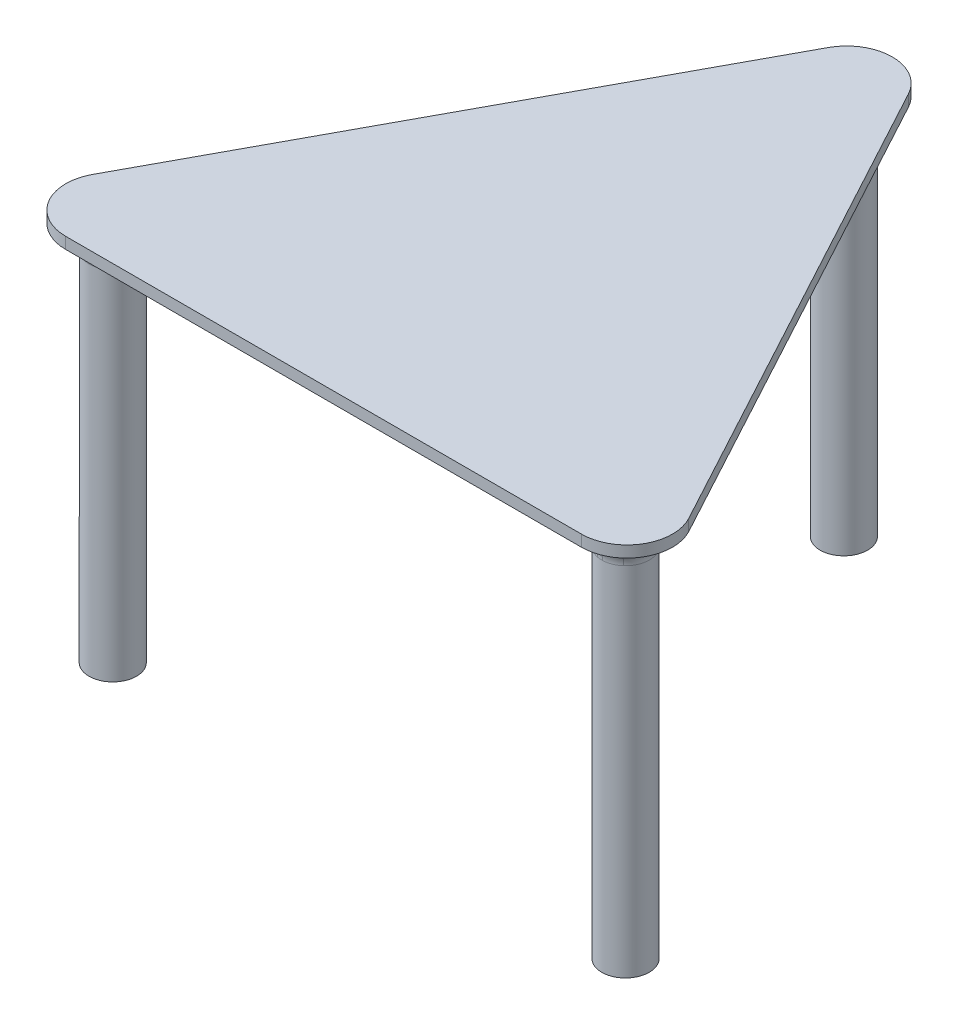
from build123d import *

# Parameters (mm, degrees)
BOSS_EXTRUDE1_DEPTH = 1.2
SKETCH1_3_R         = 2.5
SKETCH1_3_R_2       = 1
BOSS_EXTRUDE2_DEPTH = 40
SKETCH2_W           = 0.284935897
SKETCH2_H           = 2.320192307
BOSS_EXTRUDE3_DEPTH = 1
FILLET1_R           = 2.4


with BuildPart() as part:
    # Sketch1 → Boss-Extrude1 (new body)
    with BuildSketch(Plane(origin=(0, 0, 0), x_dir=(1, 0, 0), z_dir=(0, 1, 0))):
        with BuildLine():
            ThreePointArc((-36.713966374, 35.400707195), (-40.937728938, 37.920393664), (-45.161491502, 35.400707195))
            Line((-45.161491502, 35.400707195), (-72.315228381, -14.895419069))
            ThreePointArc((-72.315228381, -14.895419069), (-72.213692457, -19.634847792), (-68.091465817, -21.975732601))
            Line((-68.091465817, -21.975732601), (-13.783992059, -21.975732601))
            ThreePointArc((-13.783992059, -21.975732601), (-9.661765418, -19.634847792), (-9.560229495, -14.895419069))
            Line((-9.560229495, -14.895419069), (-36.713966374, 35.400707195))
        make_face()
    extrude(amount=BOSS_EXTRUDE1_DEPTH)

    # Sketch1<3> → Boss-Extrude2 (add)
    # profile 1 of 3: a face of its own
    with BuildSketch(Plane(origin=(0, 0, 0), x_dir=(1, 0, 0), z_dir=(0, 1, 0))):
        with Locations((-13.937728938, -17.175732601)):
            Circle(SKETCH1_3_R)
        with Locations((-13.937728938, -17.175732601)):
            Circle(SKETCH1_3_R_2, mode=Mode.SUBTRACT)
    # profile 2 of 3: a face of its own
    with BuildSketch(Plane(origin=(0, 0, 0), x_dir=(1, 0, 0), z_dir=(0, 1, 0))):
        with Locations((-67.937728938, -17.175732601)):
            Circle(SKETCH1_3_R)
        with Locations((-67.937728938, -17.175732601)):
            Circle(SKETCH1_3_R_2, mode=Mode.SUBTRACT)
    # profile 3 of 3: a face of its own
    with BuildSketch(Plane(origin=(0, 0, 0), x_dir=(1, 0, 0), z_dir=(0, 1, 0))):
        with Locations((-40.937728938, 32.824267399)):
            Circle(SKETCH1_3_R)
        with Locations((-40.937728938, 32.824267399)):
            Circle(SKETCH1_3_R_2, mode=Mode.SUBTRACT)
    extrude(amount=-BOSS_EXTRUDE2_DEPTH)

    # Sketch2 → Boss-Extrude3 (add)
    # profile 1 of 17: a face of its own
    with BuildSketch(Plane.XZ):
        with BuildLine():
            Line((-40.001510989, -2.633112981), (-39.75728022, -2.401602564))
            add(Edge.make_bspline(
                [(-39.75728022, -2.401602564), (-39.712826443, -2.443120614), (-39.625214909, -2.524946281), (-39.483061205, -2.63229787), (-39.334540726, -2.723543655), (-39.180860952, -2.798509022), (-39.024985409, -2.856782239), (-38.870026153, -2.898916848), (-38.717069599, -2.926014547), (-38.615523426, -2.929197561), (-38.565383185, -2.930769231)],
                knots=[0, 0, 0, 0, 1.091957225, 2.152079168, 3.193085318, 4.218301889, 5.218403563, 6.17723952, 7.099979378, 8, 8, 8, 8], degree=3))
            add(Edge.make_bspline(
                [(-38.565383185, -2.930769231), (-38.534617879, -2.930393477), (-38.47316706, -2.929642944), (-38.381886013, -2.920086081), (-38.291574497, -2.906298425), (-38.20254395, -2.886554371), (-38.114440396, -2.860910184), (-38.027459833, -2.829948652), (-37.941770132, -2.792677572), (-37.857822087, -2.75018513), (-37.77602237, -2.703797638), (-37.699089302, -2.652061848), (-37.626702061, -2.596569825), (-37.559372537, -2.536593802), (-37.496178465, -2.473132011), (-37.438276644, -2.405282735), (-37.384400844, -2.334050205), (-37.336566206, -2.258413355), (-37.293330753, -2.18052128), (-37.255892533, -2.100994882), (-37.223656058, -2.020395043), (-37.197897146, -1.938676329), (-37.177187966, -1.855890921), (-37.16252974, -1.772168163), (-37.154296612, -1.687095554), (-37.152869463, -1.630129853), (-37.152152015, -1.601492388)],
                knots=[0, 0, 0, 0, 1.028307134, 2.053947307, 3.065600992, 4.082111276, 5.100671203, 6.132125737, 7.167228006, 8.222953114, 9.277225349, 10.309459149, 11.320441984, 12.324791754, 13.322338422, 14.312705492, 15.305176196, 16.306142747, 17.302479595, 18.282363326, 19.243345101, 20.20291386, 21.145121196, 22.094978082, 23.042318507, 24, 24, 24, 24], degree=3))
            add(Edge.make_bspline(
                [(-37.152152015, -1.601492388), (-37.152844114, -1.57221993), (-37.154226423, -1.513754947), (-37.162891828, -1.426466552), (-37.179516094, -1.340652494), (-37.199822435, -1.255503207), (-37.228565506, -1.17210551), (-37.261978431, -1.089238073), (-37.302266928, -1.007671048), (-37.348660031, -0.927972994), (-37.399929391, -0.850414424), (-37.456307469, -0.776742499), (-37.517900744, -0.707818201), (-37.583576791, -0.642633827), (-37.653934825, -0.581601015), (-37.729657233, -0.525455353), (-37.809684102, -0.473328676), (-37.894050917, -0.425793632), (-37.981865956, -0.383332663), (-38.071905718, -0.345573558), (-38.1644596, -0.314477378), (-38.259040734, -0.289133507), (-38.355536493, -0.268359671), (-38.454436655, -0.254995205), (-38.555014041, -0.245297095), (-38.622812657, -0.244588008), (-38.656969723, -0.244230769)],
                knots=[0, 0, 0, 0, 0.935896426, 1.86923723, 2.799743935, 3.728471844, 4.66505513, 5.616527375, 6.583419551, 7.570341864, 8.562833498, 9.553750335, 10.533080376, 11.5155245, 12.510142773, 13.507781369, 14.526649666, 15.561487327, 16.601173999, 17.643331812, 18.680652164, 19.71969803, 20.772446191, 21.833473655, 22.9085001, 24, 24, 24, 24], degree=3))
            add(Edge.make_bspline(
                [(-38.656969723, -0.244230769), (-38.698134534, -0.245090907), (-38.778968329, -0.246779926), (-38.897789364, -0.259938825), (-39.011919391, -0.28046426), (-39.120986812, -0.310616848), (-39.225387635, -0.348782498), (-39.324736127, -0.395980115), (-39.419309146, -0.451711532), (-39.508687937, -0.514854046), (-39.590782234, -0.58518822), (-39.665401319, -0.660469815), (-39.730358594, -0.741299507), (-39.786077685, -0.827659706), (-39.834035778, -0.918278787), (-39.872291319, -1.014709946), (-39.901880136, -1.115876098), (-39.91398456, -1.185814892), (-39.920100733, -1.221153846)],
                knots=[0, 0, 0, 0, 1.130234505, 2.219399076, 3.279128566, 4.311639422, 5.322903917, 6.328167287, 7.327698761, 8.334124803, 9.329374007, 10.292761544, 11.24113083, 12.171311216, 13.111441694, 14.052040787, 15.015727358, 16, 16, 16, 16], degree=3))
            Line((-39.920100733, -1.221153846), (-38.861767399, -1.221153846))
            Line((-38.861767399, -1.221153846), (-38.861767399, -1.546794872))
            Line((-38.861767399, -1.546794872), (-40.20503663, -1.546794872))
            add(Edge.make_bspline(
                [(-40.20503663, -1.546794872), (-40.203489182, -1.486100221), (-40.200460546, -1.367309826), (-40.179216244, -1.194072509), (-40.144911265, -1.030449616), (-40.098047982, -0.876268829), (-40.037382549, -0.731748642), (-39.963566042, -0.59674232), (-39.875417046, -0.472122045), (-39.776075431, -0.356870449), (-39.664587612, -0.254064664), (-39.543966078, -0.163707849), (-39.414011543, -0.087596191), (-39.274846932, -0.025674018), (-39.126927824, 0.022653106), (-38.969911937, 0.056917322), (-38.804012199, 0.077445931), (-38.690313928, 0.080068825), (-38.632165035, 0.081410256)],
                knots=[0, 0, 0, 0, 1.140356446, 2.231883559, 3.274166699, 4.278491846, 5.25512956, 6.21435461, 7.1637429, 8.11826594, 9.068280886, 10.0076534, 10.945064095, 11.891975133, 12.864533718, 13.863980011, 14.907571808, 16, 16, 16, 16], degree=3))
            add(Edge.make_bspline(
                [(-38.632165035, 0.081410256), (-38.596323698, 0.080893982), (-38.52563303, 0.079875723), (-38.421229117, 0.072639129), (-38.319703847, 0.061498892), (-38.22107201, 0.044675816), (-38.1249708, 0.02407038), (-38.031880176, -0.00231543), (-37.941445525, -0.03285775), (-37.853527066, -0.067597396), (-37.768922799, -0.107848828), (-37.687255887, -0.152579715), (-37.608074901, -0.201559407), (-37.531919202, -0.25563496), (-37.458391988, -0.314401906), (-37.387967364, -0.377978032), (-37.320251075, -0.446168976), (-37.277832654, -0.494591364), (-37.256458906, -0.518990385)],
                knots=[0, 0, 0, 0, 1.107784379, 2.184907829, 3.233506516, 4.263428166, 5.276301166, 6.270063455, 7.25232949, 8.225834625, 9.190232166, 10.146266622, 11.1027726, 12.066435141, 13.031522626, 14.010570082, 14.99756817, 16, 16, 16, 16], degree=3))
            add(Edge.make_bspline(
                [(-37.256458906, -0.518990385), (-37.225447382, -0.557698763), (-37.163939093, -0.634473), (-37.084765337, -0.757481521), (-37.017272636, -0.884846065), (-36.962510397, -1.016921192), (-36.919749419, -1.153583364), (-36.889082318, -1.29465795), (-36.871114277, -1.440326615), (-36.868525711, -1.538901533), (-36.867216117, -1.588772035)],
                knots=[0, 0, 0, 0, 1.023165419, 2.029347347, 3.013907458, 3.994755782, 4.975994455, 5.96558838, 6.970761222, 8, 8, 8, 8], degree=3))
            add(Edge.make_bspline(
                [(-36.867216117, -1.588772035), (-36.867700241, -1.626115315), (-36.868662337, -1.700327263), (-36.880277668, -1.810512168), (-36.897042372, -1.918713334), (-36.9213254, -2.025030945), (-36.953275779, -2.128992998), (-36.991646956, -2.231398331), (-37.036590518, -2.331837636), (-37.089038007, -2.429420693), (-37.14612649, -2.524114129), (-37.21032159, -2.612937451), (-37.278057155, -2.697608132), (-37.352578316, -2.77572898), (-37.431092595, -2.849795643), (-37.515552923, -2.91785595), (-37.604573603, -2.981058206), (-37.698873445, -3.038165646), (-37.79695667, -3.089481048), (-37.898612179, -3.134464445), (-38.003802459, -3.171642465), (-38.111741179, -3.20318717), (-38.22324489, -3.226514498), (-38.337504562, -3.243431568), (-38.455115733, -3.255007257), (-38.534614131, -3.255938217), (-38.574923449, -3.256410256)],
                knots=[0, 0, 0, 0, 1.009025537, 2.005226976, 2.991671811, 3.967589759, 4.950148279, 5.929425679, 6.922109907, 7.921964004, 8.922507644, 9.908469609, 10.882248289, 11.851158214, 12.824245259, 13.798023939, 14.780666017, 15.773333703, 16.775582742, 17.771174102, 18.775387309, 19.789283316, 20.80873549, 21.851817535, 22.910773411, 24, 24, 24, 24], degree=3))
            add(Edge.make_bspline(
                [(-38.574923449, -3.256410256), (-38.607796953, -3.255885888), (-38.672981249, -3.254846128), (-38.769974645, -3.247601828), (-38.865277878, -3.236246934), (-38.959369026, -3.220369016), (-39.051889831, -3.199365104), (-39.143120601, -3.173767414), (-39.232888788, -3.144130235), (-39.321087598, -3.108756683), (-39.408316684, -3.068613714), (-39.495059271, -3.023425441), (-39.581019467, -2.972421436), (-39.666346208, -2.915449628), (-39.751577595, -2.853488678), (-39.83536552, -2.784766415), (-39.919732477, -2.711992915), (-39.973981265, -2.659666934), (-40.001510989, -2.633112981)],
                knots=[0, 0, 0, 0, 0.985875312, 1.954874891, 2.915472732, 3.863573565, 4.815313299, 5.759461513, 6.704487138, 7.649063459, 8.607849844, 9.583336382, 10.581114205, 11.603942397, 12.659508253, 13.739925933, 14.853076422, 16, 16, 16, 16], degree=3))
        make_face()
    # profile 2 of 17: a face of its own
    with BuildSketch(Plane.XZ):
        with BuildLine():
            Line((-40.856318681, -3.175), (-41.478979939, -3.175))
            add(Edge.make_bspline(
                [(-41.478979939, -3.175), (-41.521806976, -3.174952923), (-41.603865479, -3.17486272), (-41.721535565, -3.172127915), (-41.828405822, -3.16847513), (-41.92424581, -3.163411556), (-42.009350414, -3.157427506), (-42.083334535, -3.149034585), (-42.146779704, -3.140271317), (-42.184794841, -3.131361898), (-42.202131983, -3.127298678)],
                knots=[0, 0, 0, 0, 1.415646017, 2.712440637, 3.8905458, 4.950247383, 5.884950622, 6.709939814, 7.411656543, 8, 8, 8, 8], degree=3))
            add(Edge.make_bspline(
                [(-42.202131983, -3.127298678), (-42.224078835, -3.121291442), (-42.267455388, -3.109418524), (-42.329960495, -3.085641554), (-42.389419708, -3.057435855), (-42.44608174, -3.025337271), (-42.498975906, -2.987829956), (-42.549753664, -2.947078705), (-42.597350131, -2.901435441), (-42.641046615, -2.850960257), (-42.681533295, -2.7973067), (-42.715423547, -2.739106633), (-42.745349974, -2.678379041), (-42.768671911, -2.61364124), (-42.787003849, -2.545747762), (-42.80035502, -2.4745219), (-42.808936102, -2.400117305), (-42.809750339, -2.349261248), (-42.810164835, -2.323372396)],
                knots=[0, 0, 0, 0, 0.999333726, 1.975119402, 2.933498163, 3.889020618, 4.832249799, 5.779334906, 6.747801194, 7.724875447, 8.710438469, 9.696133548, 10.679360639, 11.681339199, 12.714023775, 13.766351759, 14.862936069, 16, 16, 16, 16], degree=3))
            add(Edge.make_bspline(
                [(-42.810164835, -2.323372396), (-42.809782543, -2.297266841), (-42.809034562, -2.24618956), (-42.800057217, -2.171465674), (-42.787964829, -2.100056849), (-42.769371074, -2.032121418), (-42.745018214, -1.968062827), (-42.716450423, -1.906902138), (-42.681993935, -1.849679864), (-42.642401839, -1.796188264), (-42.598358607, -1.74637713), (-42.550050585, -1.700607423), (-42.497672798, -1.659147059), (-42.441391707, -1.62190309), (-42.380658629, -1.589739179), (-42.316394676, -1.560930767), (-42.248041265, -1.536736305), (-42.200740556, -1.524009035), (-42.176691277, -1.517538061)],
                knots=[0, 0, 0, 0, 1.121902311, 2.195077645, 3.232258892, 4.234102512, 5.217864754, 6.176164875, 7.132989551, 8.084763148, 9.034132444, 9.988522005, 10.94243251, 11.903244335, 12.886203696, 13.894208494, 14.929344452, 16, 16, 16, 16], degree=3))
            add(Edge.make_bspline(
                [(-42.176691277, -1.517538061), (-42.156799827, -1.513311223), (-42.113206555, -1.504047863), (-42.041417302, -1.493636106), (-41.957790866, -1.485097327), (-41.862611782, -1.477128871), (-41.755658094, -1.472906585), (-41.637175103, -1.467948932), (-41.506761822, -1.465609687), (-41.415802625, -1.465461818), (-41.368312872, -1.465384615)],
                knots=[0, 0, 0, 0, 0.601372724, 1.317943291, 2.144091499, 3.08771165, 4.142394186, 5.309582461, 6.595334295, 8, 8, 8, 8], degree=3))
            Line((-41.368312872, -1.465384615), (-41.141254579, -1.465384615))
            Line((-41.141254579, -1.465384615), (-41.141254579, 0))
            Line((-41.141254579, 0), (-40.856318681, 0))
            Line((-40.856318681, 0), (-40.856318681, -3.175))
        make_face()
        with BuildLine():
            Line((-41.141254579, -2.849358974), (-41.141254579, -1.791025641))
            Line((-41.141254579, -1.791025641), (-41.697133986, -1.784029447))
            add(Edge.make_bspline(
                [(-41.697133986, -1.784029447), (-41.72427609, -1.78401155), (-41.776673362, -1.783977001), (-41.8525672, -1.78765416), (-41.922809658, -1.791654494), (-41.987504446, -1.798123984), (-42.046356278, -1.806014745), (-42.099507644, -1.816564732), (-42.147382718, -1.827325038), (-42.2025295, -1.845996077), (-42.264299679, -1.874163711), (-42.331342199, -1.916235582), (-42.388624534, -1.969235561), (-42.43777553, -2.029470587), (-42.476626034, -2.096550103), (-42.504782679, -2.168122007), (-42.521968911, -2.243914532), (-42.524129075, -2.295722136), (-42.525228938, -2.322100361)],
                knots=[0, 0, 0, 0, 1.160501667, 2.240324542, 3.248665471, 4.168823117, 5.020172044, 5.786515869, 6.485785279, 7.116517804, 8.272762037, 9.381837012, 10.485674779, 11.594342068, 12.695271952, 13.786226926, 14.872841088, 16, 16, 16, 16], degree=3))
            add(Edge.make_bspline(
                [(-42.525228938, -2.322100361), (-42.524080005, -2.347624004), (-42.52179607, -2.398361847), (-42.504924644, -2.472757928), (-42.476327847, -2.543516172), (-42.437743857, -2.610064019), (-42.389770692, -2.670138949), (-42.333627584, -2.721957753), (-42.270188031, -2.763899007), (-42.211635961, -2.791818901), (-42.15923647, -2.808191748), (-42.113941875, -2.820012114), (-42.062539438, -2.828164369), (-42.00551562, -2.835964545), (-41.942943428, -2.842260983), (-41.874424981, -2.846633432), (-41.80018851, -2.849165555), (-41.748653448, -2.84929294), (-41.721938673, -2.849358974)],
                knots=[0, 0, 0, 0, 1.12039168, 2.227199994, 3.330242575, 4.460839274, 5.593542475, 6.693949254, 7.801736126, 8.92216649, 9.528704869, 10.210659466, 10.975987387, 11.81211542, 12.738540127, 13.736887663, 14.826846554, 16, 16, 16, 16], degree=3))
            Line((-41.721938673, -2.849358974), (-41.141254579, -2.849358974))
        make_face(mode=Mode.SUBTRACT)
    # profile 3 of 17: a face of its own
    with BuildSketch(Plane.XZ):
        with BuildLine():
            Line((-43.135805861, -0.612484976), (-43.4042053, -0.773397436))
            add(Edge.make_bspline(
                [(-43.4042053, -0.773397436), (-43.429168272, -0.731610458), (-43.476996364, -0.651548221), (-43.556780811, -0.543364142), (-43.639451381, -0.451414185), (-43.725620276, -0.376233263), (-43.814761529, -0.317043201), (-43.907457063, -0.275131177), (-44.003394506, -0.24899097), (-44.068685044, -0.245815892), (-44.10128062, -0.244230769)],
                knots=[0, 0, 0, 0, 1.272034388, 2.437168799, 3.508375237, 4.49857839, 5.41946034, 6.295179144, 7.148887113, 8, 8, 8, 8], degree=3))
            add(Edge.make_bspline(
                [(-44.10128062, -0.244230769), (-44.129112354, -0.245024523), (-44.184288831, -0.246598143), (-44.265676648, -0.261107727), (-44.344325195, -0.284845299), (-44.419451703, -0.317024422), (-44.489069289, -0.356578588), (-44.551086659, -0.403223773), (-44.603487032, -0.457108573), (-44.646807928, -0.516290124), (-44.680720242, -0.579533065), (-44.704849661, -0.645279892), (-44.720349878, -0.713111649), (-44.722315083, -0.759110766), (-44.723305861, -0.782301683)],
                knots=[0, 0, 0, 0, 1.095645842, 2.172120455, 3.244862764, 4.326153987, 5.384857088, 6.392105572, 7.372507978, 8.334705661, 9.272564127, 10.189475455, 11.087205874, 12, 12, 12, 12], degree=3))
            add(Edge.make_bspline(
                [(-44.723305861, -0.782301683), (-44.721997175, -0.80874542), (-44.719346944, -0.86229687), (-44.695990279, -0.941440927), (-44.66032563, -1.020101336), (-44.626804868, -1.068767031), (-44.609458705, -1.093950321)],
                knots=[0, 0, 0, 0, 0.938992559, 1.901562324, 2.914110574, 4, 4, 4, 4], degree=3))
            add(Edge.make_bspline(
                [(-44.609458705, -1.093950321), (-44.595285553, -1.112175133), (-44.565443451, -1.150548157), (-44.513385, -1.20666466), (-44.454191262, -1.266081679), (-44.38632969, -1.327613262), (-44.310789849, -1.392518085), (-44.226715332, -1.459592409), (-44.135087838, -1.529836622), (-44.070460299, -1.576230904), (-44.03704284, -1.600220353)],
                knots=[0, 0, 0, 0, 0.722283655, 1.520795216, 2.39349503, 3.346893347, 4.386874146, 5.510198126, 6.712579003, 8, 8, 8, 8], degree=3))
            add(Edge.make_bspline(
                [(-44.03704284, -1.600220353), (-44.003642671, -1.624018874), (-43.93978409, -1.669519836), (-43.850410486, -1.736962888), (-43.770597962, -1.799017949), (-43.699939834, -1.854820612), (-43.640264118, -1.906804708), (-43.589389236, -1.952184181), (-43.549192155, -1.993382241), (-43.526823427, -2.020086685), (-43.51678042, -2.032076322)],
                knots=[0, 0, 0, 0, 1.452255772, 2.776602448, 3.96446981, 5.032613149, 5.964194703, 6.766668629, 7.446264616, 8, 8, 8, 8], degree=3))
            add(Edge.make_bspline(
                [(-43.51678042, -2.032076322), (-43.502746964, -2.050765333), (-43.475148288, -2.087519782), (-43.43867846, -2.144951255), (-43.407923354, -2.203629868), (-43.383171244, -2.263768287), (-43.36315515, -2.324914535), (-43.349238831, -2.387527674), (-43.340661105, -2.451182649), (-43.339775051, -2.494010556), (-43.339331502, -2.51544972)],
                knots=[0, 0, 0, 0, 1.068019517, 2.100403715, 3.106014851, 4.09224787, 5.069873182, 6.043214339, 7.020455327, 8, 8, 8, 8], degree=3))
            add(Edge.make_bspline(
                [(-43.339331502, -2.51544972), (-43.340510295, -2.549043893), (-43.342842687, -2.615514189), (-43.362730853, -2.712564684), (-43.393751039, -2.805509219), (-43.438630137, -2.892279183), (-43.494064219, -2.972751576), (-43.55986458, -3.045498884), (-43.637263474, -3.108017057), (-43.72342821, -3.161162502), (-43.816640695, -3.203560713), (-43.914601549, -3.234454706), (-44.01687059, -3.252560472), (-44.0863692, -3.255114386), (-44.121633185, -3.256410256)],
                knots=[0, 0, 0, 0, 1.005367131, 1.989245246, 2.955191616, 3.932180104, 4.904534562, 5.875498653, 6.859376768, 7.874484044, 8.900379497, 9.918679785, 10.943926428, 12, 12, 12, 12], degree=3))
            add(Edge.make_bspline(
                [(-44.121633185, -3.256410256), (-44.159059038, -3.255161392), (-44.233278981, -3.252684746), (-44.342484942, -3.229826556), (-44.44825584, -3.194310897), (-44.533022914, -3.152012432), (-44.599390043, -3.110221615), (-44.649948891, -3.07206033), (-44.701462324, -3.028222277), (-44.753375306, -2.977778761), (-44.806200748, -2.921740037), (-44.8596952, -2.859631337), (-44.914359314, -2.792012477), (-44.94951444, -2.743728186), (-44.96753663, -2.718975361)],
                knots=[0, 0, 0, 0, 1.286534051, 2.551350862, 3.822568981, 5.117864672, 5.799956111, 6.519305446, 7.295594771, 8.126302591, 9.008831062, 9.944975596, 10.946496709, 12, 12, 12, 12], degree=3))
            Line((-44.96753663, -2.718975361), (-44.709949491, -2.523717949))
            add(Edge.make_bspline(
                [(-44.709949491, -2.523717949), (-44.694396815, -2.543756707), (-44.664445997, -2.582346669), (-44.618956304, -2.63637093), (-44.576146154, -2.685786748), (-44.533645003, -2.728595243), (-44.494728976, -2.76800256), (-44.456287442, -2.801141703), (-44.419805454, -2.82906474), (-44.373925292, -2.858902893), (-44.315657357, -2.887771526), (-44.243195681, -2.912591669), (-44.167421193, -2.927845119), (-44.115979567, -2.929783812), (-44.089832303, -2.930769231)],
                knots=[0, 0, 0, 0, 1.181426797, 2.275151783, 3.28963443, 4.225459815, 5.084396437, 5.868484344, 6.587427557, 7.222918358, 8.415355282, 9.605213164, 10.782753814, 12, 12, 12, 12], degree=3))
            add(Edge.make_bspline(
                [(-44.089832303, -2.930769231), (-44.057025432, -2.929688044), (-43.993760471, -2.927603078), (-43.904152001, -2.904232925), (-43.823033974, -2.868700181), (-43.753503056, -2.817462336), (-43.696092456, -2.756376955), (-43.654048475, -2.68671338), (-43.628911117, -2.609772672), (-43.625834348, -2.556126979), (-43.624267399, -2.52880609)],
                knots=[0, 0, 0, 0, 1.144248881, 2.206576175, 3.214949548, 4.222996039, 5.203671638, 6.127710127, 7.046472867, 8, 8, 8, 8], degree=3))
            add(Edge.make_bspline(
                [(-43.624267399, -2.52880609), (-43.624661246, -2.511804191), (-43.625454427, -2.477563549), (-43.634911065, -2.427079329), (-43.649023114, -2.377189424), (-43.669026555, -2.327606397), (-43.696211467, -2.27691767), (-43.73313335, -2.225412158), (-43.779336198, -2.171800813), (-43.814795667, -2.136966296), (-43.833517199, -2.11857472)],
                knots=[0, 0, 0, 0, 0.858500039, 1.728959331, 2.587258638, 3.476905708, 4.426389682, 5.487945037, 6.673710648, 8, 8, 8, 8], degree=3))
            add(Edge.make_bspline(
                [(-43.833517199, -2.11857472), (-43.840467158, -2.11237256), (-43.856978671, -2.09763765), (-43.887164689, -2.073514653), (-43.927027084, -2.043757852), (-43.975524938, -2.006939358), (-44.033552474, -1.964229746), (-44.101116071, -1.916175112), (-44.177462604, -1.861215445), (-44.231638914, -1.822791105), (-44.260285027, -1.802473958)],
                knots=[0, 0, 0, 0, 0.420754252, 0.999615792, 1.744751191, 2.668019286, 3.750313428, 4.999500688, 6.413464383, 8, 8, 8, 8], degree=3))
            add(Edge.make_bspline(
                [(-44.260285027, -1.802473958), (-44.294743653, -1.777399279), (-44.361468006, -1.728845637), (-44.456407711, -1.655897367), (-44.542488825, -1.584551785), (-44.620019942, -1.51526914), (-44.689745683, -1.448559477), (-44.750963173, -1.383671938), (-44.803950169, -1.321032045), (-44.861773497, -1.241269918), (-44.920157918, -1.142401842), (-44.970217761, -1.021215199), (-45.002064975, -0.899680788), (-45.00620105, -0.818100612), (-45.008241758, -0.777849559)],
                knots=[0, 0, 0, 0, 1.163604038, 2.253157948, 3.268574773, 4.215621239, 5.091738613, 5.902582348, 6.650434646, 7.330118262, 8.591011492, 9.77460283, 10.902005569, 12, 12, 12, 12], degree=3))
            add(Edge.make_bspline(
                [(-45.008241758, -0.777849559), (-45.007644701, -0.749385426), (-45.006462181, -0.693009912), (-44.992904149, -0.610220872), (-44.9729691, -0.529848461), (-44.943258308, -0.452892879), (-44.906118954, -0.37849645), (-44.860902088, -0.306789617), (-44.806104394, -0.238950603), (-44.745230731, -0.173661953), (-44.677615493, -0.114614824), (-44.606064766, -0.062022474), (-44.530980147, -0.01699173), (-44.451504184, 0.018385422), (-44.368946063, 0.046684119), (-44.282918247, 0.06696788), (-44.193235882, 0.079459274), (-44.132274564, 0.080752669), (-44.10128062, 0.081410256)],
                knots=[0, 0, 0, 0, 0.98378539, 1.948466333, 2.894822735, 3.844243623, 4.795447569, 5.768042124, 6.770299647, 7.807997672, 8.852593179, 9.870666288, 10.876941106, 11.874841786, 12.874492863, 13.892063892, 14.928283473, 16, 16, 16, 16], degree=3))
            add(Edge.make_bspline(
                [(-44.10128062, 0.081410256), (-44.077301046, 0.080941228), (-44.029643896, 0.080009079), (-43.959342412, 0.07196351), (-43.890331882, 0.060164582), (-43.823478794, 0.042175506), (-43.757950783, 0.019835875), (-43.694331657, -0.007515565), (-43.632467947, -0.040076834), (-43.572283235, -0.077898299), (-43.513226659, -0.121497566), (-43.455536565, -0.171837516), (-43.398924158, -0.228677189), (-43.343154277, -0.291937488), (-43.289540651, -0.36266406), (-43.236735059, -0.439735266), (-43.185012461, -0.523400093), (-43.152514419, -0.582235375), (-43.135805861, -0.612484976)],
                knots=[0, 0, 0, 0, 0.915366252, 1.81920441, 2.69897508, 3.586533125, 4.459536084, 5.340758185, 6.227946952, 7.126403341, 8.052553006, 9.028121456, 10.047063623, 11.114014537, 12.24582441, 13.433687931, 14.680555077, 16, 16, 16, 16], degree=3))
        make_face()
    # profile 4 of 17: a face of its own
    with BuildSketch(Plane.XZ):
        Polygon((-26.568818681, 2.994551282), (-26.853754579, 2.994551282), (-26.853754579, 3.930769231), (-27.260805861, 3.930769231), (-27.260805861, 4.215705128), (-26.853754579, 4.215705128), (-26.853754579, 6.250961538), (-26.568818681, 6.250961538), (-26.568818681, 4.215705128), (-26.161767399, 4.215705128), (-26.161767399, 3.930769231), (-26.568818681, 3.930769231), align=None)
    # profile 5 of 17: a face of its own
    with BuildSketch(Plane.XZ):
        with BuildLine():
            Line((-27.789972527, 2.994551282), (-28.074908425, 2.994551282))
            Line((-28.074908425, 2.994551282), (-28.074908425, 4.368985377))
            add(Edge.make_bspline(
                [(-28.074908425, 4.368985377), (-28.105543536, 4.330807923), (-28.16509702, 4.256592414), (-28.264652204, 4.158712502), (-28.368389434, 4.075342094), (-28.477189061, 4.007262162), (-28.590588683, 3.954448671), (-28.708866951, 3.917500051), (-28.831722323, 3.894459711), (-28.915411241, 3.891539661), (-28.957700893, 3.890064103)],
                knots=[0, 0, 0, 0, 1.12556596, 2.18805719, 3.205172764, 4.182516927, 5.13416184, 6.075333115, 7.027428072, 8, 8, 8, 8], degree=3))
            add(Edge.make_bspline(
                [(-28.957700893, 3.890064103), (-29.000657029, 3.891557813), (-29.084774694, 3.89448283), (-29.206808817, 3.920255936), (-29.321582553, 3.961042322), (-29.42756275, 4.018364576), (-29.523112939, 4.089537409), (-29.605987274, 4.173010883), (-29.675509661, 4.267685574), (-29.722025289, 4.355933438), (-29.75251172, 4.434411313), (-29.771782986, 4.501760339), (-29.788131165, 4.576799128), (-29.802372396, 4.659499117), (-29.811864564, 4.750254211), (-29.819488692, 4.848655907), (-29.824910208, 4.954698278), (-29.825120303, 5.028104506), (-29.825228938, 5.066060697)],
                knots=[0, 0, 0, 0, 1.235689485, 2.419754739, 3.574485241, 4.732583367, 5.875375667, 6.993392835, 8.106934443, 9.24564317, 9.854426656, 10.528623913, 11.260290605, 12.06517837, 12.94359002, 13.886555271, 14.907200199, 16, 16, 16, 16], degree=3))
            Line((-29.825228938, 5.066060697), (-29.825228938, 6.250961538))
            Line((-29.825228938, 6.250961538), (-29.54029304, 6.250961538))
            Line((-29.54029304, 6.250961538), (-29.54029304, 5.159555288))
            add(Edge.make_bspline(
                [(-29.54029304, 5.159555288), (-29.540121098, 5.127966112), (-29.539792203, 5.067541393), (-29.53869164, 4.981031236), (-29.536290716, 4.902776778), (-29.532267502, 4.832615576), (-29.528219207, 4.770642713), (-29.522479782, 4.716756964), (-29.515851933, 4.671296369), (-29.509892727, 4.643932767), (-29.507220124, 4.631660657)],
                knots=[0, 0, 0, 0, 1.430934443, 2.737134061, 3.918973087, 4.976914145, 5.92044225, 6.731742364, 7.431207999, 8, 8, 8, 8], degree=3))
            add(Edge.make_bspline(
                [(-29.507220124, 4.631660657), (-29.496904815, 4.595625855), (-29.477126084, 4.52653218), (-29.430235688, 4.432845741), (-29.37303275, 4.352243772), (-29.30213032, 4.287015611), (-29.219883805, 4.235619819), (-29.125512381, 4.200603838), (-29.020221946, 4.178273766), (-28.946164102, 4.176123764), (-28.9074555, 4.175)],
                knots=[0, 0, 0, 0, 1.090171874, 2.090312098, 3.036871164, 3.954896932, 4.878889889, 5.844924892, 6.87358393, 8, 8, 8, 8], degree=3))
            add(Edge.make_bspline(
                [(-28.9074555, 4.175), (-28.884531982, 4.175425429), (-28.839166933, 4.176267343), (-28.771933216, 4.184933976), (-28.706510843, 4.198621753), (-28.643075407, 4.21883982), (-28.581497507, 4.243421167), (-28.521526837, 4.273587396), (-28.463984131, 4.310061615), (-28.408126681, 4.351112985), (-28.356128887, 4.396526653), (-28.307754248, 4.444468139), (-28.264630006, 4.495517114), (-28.225560688, 4.54885734), (-28.19183466, 4.60521972), (-28.162395081, 4.664060932), (-28.13741627, 4.725458305), (-28.125004114, 4.768071397), (-28.118793641, 4.789393029)],
                knots=[0, 0, 0, 0, 1.024369801, 2.02720137, 3.025498567, 4.008789058, 4.999724648, 5.987391013, 7.005161842, 8.042127274, 9.083588116, 10.088924978, 11.084112559, 12.068088063, 13.041783903, 14.016724555, 15.007660144, 16, 16, 16, 16], degree=3))
            add(Edge.make_bspline(
                [(-28.118793641, 4.789393029), (-28.115220018, 4.804833463), (-28.107432653, 4.838480069), (-28.098982769, 4.89397392), (-28.091419196, 4.958459415), (-28.085025154, 5.031838745), (-28.081103497, 5.1143808), (-28.076877808, 5.205522313), (-28.075304809, 5.305834189), (-28.075044502, 5.3755894), (-28.074908425, 5.412054287)],
                knots=[0, 0, 0, 0, 0.607992626, 1.324890765, 2.152360218, 3.099583803, 4.150613268, 5.323148443, 6.60066238, 8, 8, 8, 8], degree=3))
            Line((-28.074908425, 5.412054287), (-28.074908425, 6.250961538))
            Line((-28.074908425, 6.250961538), (-27.789972527, 6.250961538))
            Line((-27.789972527, 6.250961538), (-27.789972527, 2.994551282))
        make_face()
    # profile 6 of 17: a face of its own
    with BuildSketch(Plane.XZ):
        with BuildLine():
            add(Edge.make_bspline(
                [(-30.577001774, 2.953846154), (-30.59468023, 2.954669907), (-30.629298042, 2.956282974), (-30.679408153, 2.969986065), (-30.72499099, 2.993567945), (-30.766025226, 3.0241778), (-30.800040722, 3.061656515), (-30.824431643, 3.104240619), (-30.840002732, 3.150600046), (-30.841894137, 3.182902307), (-30.842857143, 3.199348958)],
                knots=[0, 0, 0, 0, 1.054986045, 2.065865298, 3.074122704, 4.105114675, 5.109626121, 6.074217918, 7.019490725, 8, 8, 8, 8], degree=3))
            add(Edge.make_bspline(
                [(-30.842857143, 3.199348958), (-30.841872594, 3.215368706), (-30.839926257, 3.247037851), (-30.824443153, 3.292593464), (-30.799836233, 3.334584594), (-30.766047867, 3.371990035), (-30.724985011, 3.402582207), (-30.679409735, 3.426168759), (-30.629297625, 3.439870615), (-30.594680089, 3.441483852), (-30.577001774, 3.442307692)],
                knots=[0, 0, 0, 0, 0.961106377, 1.899993565, 2.859409042, 3.870007927, 4.90724781, 5.921615355, 6.938620636, 8, 8, 8, 8], degree=3))
            add(Edge.make_bspline(
                [(-30.577001774, 3.442307692), (-30.559526499, 3.441510311), (-30.525513158, 3.439958313), (-30.476324424, 3.426004828), (-30.431475031, 3.402633498), (-30.391111858, 3.37156668), (-30.35665359, 3.334833315), (-30.332137462, 3.292561745), (-30.316612962, 3.247045926), (-30.314672203, 3.215371419), (-30.313690476, 3.199348958)],
                knots=[0, 0, 0, 0, 1.055304112, 2.054011575, 3.063363921, 4.096942562, 5.122536081, 6.088009498, 7.032825006, 8, 8, 8, 8], degree=3))
            add(Edge.make_bspline(
                [(-30.313690476, 3.199348958), (-30.314650555, 3.182899491), (-30.316536211, 3.1505917), (-30.332149511, 3.10427288), (-30.356446578, 3.061405671), (-30.391134123, 3.024600848), (-30.431469202, 2.993516767), (-30.476325942, 2.970149951), (-30.525512755, 2.956195286), (-30.559526362, 2.954643451), (-30.577001774, 2.953846154)],
                knots=[0, 0, 0, 0, 0.986662878, 1.937868148, 2.908513651, 3.927890639, 4.955204348, 5.958438607, 6.951092507, 8, 8, 8, 8], degree=3))
        make_face()
    # profile 7 of 17: a face of its own
    with BuildSketch(Plane.XZ):
        with Locations((-30.57827381, 5.090865385)):
            Rectangle(SKETCH2_W, SKETCH2_H)
    # profile 8 of 17: a face of its own
    with BuildSketch(Plane.XZ):
        with BuildLine():
            Line((-32.471062271, 4.220157252), (-32.277712912, 4.419230769))
            add(Edge.make_bspline(
                [(-32.277712912, 4.419230769), (-32.261032835, 4.399892521), (-32.22887561, 4.362610654), (-32.177829106, 4.312830657), (-32.126996667, 4.270677514), (-32.076646396, 4.23599269), (-32.026684332, 4.208695414), (-31.976683895, 4.189415634), (-31.926782293, 4.177311859), (-31.893409425, 4.175761364), (-31.877021806, 4.175)],
                knots=[0, 0, 0, 0, 1.265880991, 2.440469525, 3.530740057, 4.536711111, 5.468008477, 6.34654737, 7.188078389, 8, 8, 8, 8], degree=3))
            add(Edge.make_bspline(
                [(-31.877021806, 4.175), (-31.856946011, 4.175987112), (-31.817439686, 4.177929608), (-31.760874241, 4.1968489), (-31.709003822, 4.226716358), (-31.663099696, 4.267439819), (-31.624773497, 4.315698727), (-31.596047184, 4.369204118), (-31.57885728, 4.427097757), (-31.576662579, 4.467030955), (-31.575549451, 4.487284655)],
                knots=[0, 0, 0, 0, 0.999905305, 1.967672129, 2.944835807, 3.972828834, 5.013019963, 6.007753697, 6.989553527, 8, 8, 8, 8], degree=3))
            add(Edge.make_bspline(
                [(-31.575549451, 4.487284655), (-31.576557116, 4.505619867), (-31.578569606, 4.542238603), (-31.594214808, 4.596257177), (-31.619130459, 4.648923204), (-31.642416993, 4.681183841), (-31.654415636, 4.69780649)],
                knots=[0, 0, 0, 0, 0.960159726, 1.917612774, 2.927026955, 4, 4, 4, 4], degree=3))
            add(Edge.make_bspline(
                [(-31.654415636, 4.69780649), (-31.661676823, 4.706643191), (-31.677224922, 4.725564878), (-31.705426372, 4.752493014), (-31.738833855, 4.780650075), (-31.777764543, 4.809845035), (-31.822296688, 4.840108477), (-31.871777673, 4.871954486), (-31.926819047, 4.904450851), (-31.965582299, 4.925816194), (-31.985780821, 4.936949119)],
                knots=[0, 0, 0, 0, 0.667332049, 1.428932371, 2.272176193, 3.217953793, 4.268659351, 5.415594948, 6.6533338, 8, 8, 8, 8], degree=3))
            add(Edge.make_bspline(
                [(-31.985780821, 4.936949119), (-32.010471841, 4.950772608), (-32.058166762, 4.977475037), (-32.125864312, 5.01901853), (-32.187666417, 5.060032236), (-32.242719752, 5.101453885), (-32.292315209, 5.141579619), (-32.335655839, 5.181518689), (-32.372875877, 5.221376661), (-32.393693806, 5.24926163), (-32.403644402, 5.262590144)],
                knots=[0, 0, 0, 0, 1.271974443, 2.457035787, 3.569878245, 4.604907449, 5.553098313, 6.436573686, 7.252710343, 8, 8, 8, 8], degree=3))
            add(Edge.make_bspline(
                [(-32.403644402, 5.262590144), (-32.420271186, 5.289463652), (-32.453425222, 5.343049798), (-32.486310674, 5.431780523), (-32.507926655, 5.524862645), (-32.510470575, 5.588740706), (-32.511767399, 5.621304087)],
                knots=[0, 0, 0, 0, 0.995678878, 1.985397446, 2.973007791, 4, 4, 4, 4], degree=3))
            add(Edge.make_bspline(
                [(-32.511767399, 5.621304087), (-32.511116124, 5.644227514), (-32.509832716, 5.689400633), (-32.500869301, 5.755915721), (-32.485564961, 5.819574839), (-32.464366327, 5.880762769), (-32.437131228, 5.939314659), (-32.403181282, 5.994815881), (-32.363123539, 6.047255412), (-32.318518216, 6.097320908), (-32.268703186, 6.142810621), (-32.214924865, 6.182201652), (-32.1588056, 6.216470856), (-32.099111815, 6.24372229), (-32.036593502, 6.265623401), (-31.970894692, 6.280720073), (-31.902291718, 6.289771862), (-31.855637105, 6.291027079), (-31.831864555, 6.291666667)],
                knots=[0, 0, 0, 0, 1.032810722, 2.035266353, 3.017676364, 3.978389067, 4.948507077, 5.921677479, 6.903715858, 7.918386526, 8.939467451, 9.936812204, 10.918153393, 11.89693397, 12.887853058, 13.89815236, 14.929017384, 16, 16, 16, 16], degree=3))
            add(Edge.make_bspline(
                [(-31.831864555, 6.291666667), (-31.799779882, 6.290770224), (-31.73605635, 6.288989796), (-31.64183703, 6.272141964), (-31.549576153, 6.246228916), (-31.46059935, 6.209284029), (-31.376265885, 6.163863678), (-31.298649052, 6.110124026), (-31.228556404, 6.048349142), (-31.18851758, 6.00109902), (-31.168498168, 5.977473958)],
                knots=[0, 0, 0, 0, 1.014105853, 2.01412079, 3.018242674, 4.040740662, 5.055023907, 6.042888753, 7.021444376, 8, 8, 8, 8], degree=3))
            Line((-31.168498168, 5.977473958), (-31.357395404, 5.7625))
            add(Edge.make_bspline(
                [(-31.357395404, 5.7625), (-31.375331807, 5.781871822), (-31.410104237, 5.819427028), (-31.465713198, 5.86943268), (-31.522300226, 5.911343833), (-31.579300263, 5.946398931), (-31.637557063, 5.973409475), (-31.696744156, 5.992385628), (-31.756741155, 6.004581431), (-31.797038378, 6.006013159), (-31.817236149, 6.006730769)],
                knots=[0, 0, 0, 0, 1.179806542, 2.287233372, 3.337373186, 4.324005949, 5.273901747, 6.200048787, 7.097828587, 8, 8, 8, 8], degree=3))
            add(Edge.make_bspline(
                [(-31.817236149, 6.006730769), (-31.844738636, 6.005487124), (-31.898473881, 6.003057251), (-31.975442151, 5.980999733), (-32.046495762, 5.946404583), (-32.108243464, 5.897364266), (-32.160497949, 5.840309474), (-32.199098143, 5.776275655), (-32.222487082, 5.706407471), (-32.225370535, 5.657943699), (-32.226831502, 5.633388421)],
                knots=[0, 0, 0, 0, 1.072236613, 2.094970478, 3.102399718, 4.141104368, 5.155589565, 6.110053346, 7.042415349, 8, 8, 8, 8], degree=3))
            add(Edge.make_bspline(
                [(-32.226831502, 5.633388421), (-32.225876502, 5.613141394), (-32.224000684, 5.573372039), (-32.208350446, 5.515674026), (-32.184679577, 5.460629454), (-32.160736678, 5.428393119), (-32.148601334, 5.412054287)],
                knots=[0, 0, 0, 0, 1.014054094, 1.991812201, 2.982159616, 4, 4, 4, 4], degree=3))
            add(Edge.make_bspline(
                [(-32.148601334, 5.412054287), (-32.141325451, 5.403855675), (-32.12547595, 5.385996137), (-32.096366392, 5.360254591), (-32.061789305, 5.332331543), (-32.020208924, 5.303916199), (-31.973723109, 5.272437605), (-31.919849039, 5.241220988), (-31.860674765, 5.207174971), (-31.818782199, 5.184673771), (-31.796883585, 5.172911659)],
                knots=[0, 0, 0, 0, 0.615029206, 1.339755737, 2.178261527, 3.109653826, 4.166232585, 5.329982127, 6.604294388, 8, 8, 8, 8], degree=3))
            add(Edge.make_bspline(
                [(-31.796883585, 5.172911659), (-31.773255562, 5.159722589), (-31.727433284, 5.134144774), (-31.66252967, 5.094306616), (-31.603975998, 5.053787017), (-31.550363334, 5.014858941), (-31.503045851, 4.975469942), (-31.462209955, 4.935576292), (-31.426247895, 4.896786877), (-31.406338457, 4.8693029), (-31.396828497, 4.85617488)],
                knots=[0, 0, 0, 0, 1.262093308, 2.447601706, 3.550203992, 4.582594899, 5.537233252, 6.418365656, 7.244515135, 8, 8, 8, 8], degree=3))
            add(Edge.make_bspline(
                [(-31.396828497, 4.85617488), (-31.380405289, 4.829727384), (-31.347657904, 4.77699187), (-31.315296635, 4.688860676), (-31.293666091, 4.595827805), (-31.291644054, 4.531511049), (-31.290613553, 4.498732973)],
                knots=[0, 0, 0, 0, 0.984940175, 1.963941237, 2.962352981, 4, 4, 4, 4], degree=3))
            add(Edge.make_bspline(
                [(-31.290613553, 4.498732973), (-31.291097572, 4.477301128), (-31.292044865, 4.435355971), (-31.299622176, 4.373729049), (-31.313373801, 4.315162634), (-31.330823218, 4.258662752), (-31.354568142, 4.205268101), (-31.383355216, 4.154423427), (-31.417826915, 4.106952689), (-31.456615381, 4.062530451), (-31.498761194, 4.02173395), (-31.544965577, 3.986835999), (-31.59330315, 3.956571286), (-31.644831289, 3.932332072), (-31.698891836, 3.91306834), (-31.755905888, 3.9000201), (-31.8154792, 3.891243197), (-31.85621217, 3.890462794), (-31.877021806, 3.890064103)],
                knots=[0, 0, 0, 0, 1.087410352, 2.12821612, 3.143409386, 4.13688077, 5.124334423, 6.102425883, 7.096654197, 8.095527921, 9.09231389, 10.067027194, 11.028349958, 11.981147348, 12.950860869, 13.934615631, 14.944837612, 16, 16, 16, 16], degree=3))
            add(Edge.make_bspline(
                [(-31.877021806, 3.890064103), (-31.901690103, 3.891063552), (-31.951489448, 3.8930812), (-32.026177976, 3.909179372), (-32.100671876, 3.935395616), (-32.175047498, 3.97245389), (-32.249621714, 4.01906456), (-32.324060254, 4.076435943), (-32.399572514, 4.142948596), (-32.446699905, 4.193845992), (-32.471062271, 4.220157252)],
                knots=[0, 0, 0, 0, 0.845753203, 1.707371858, 2.609134499, 3.549244224, 4.552329203, 5.621587647, 6.770486714, 8, 8, 8, 8], degree=3))
        make_face()
    # profile 9 of 17: a face of its own
    with BuildSketch(Plane.XZ):
        with BuildLine():
            Line((-35.401831502, 4.220157252), (-35.208482143, 4.419230769))
            add(Edge.make_bspline(
                [(-35.208482143, 4.419230769), (-35.191802066, 4.399892521), (-35.159644841, 4.362610654), (-35.108598337, 4.312830657), (-35.057765897, 4.270677514), (-35.007415626, 4.23599269), (-34.957453563, 4.208695414), (-34.907453126, 4.189415634), (-34.857551523, 4.177311859), (-34.824178656, 4.175761364), (-34.807791037, 4.175)],
                knots=[0, 0, 0, 0, 1.265880991, 2.440469525, 3.530740057, 4.536711111, 5.468008477, 6.34654737, 7.188078389, 8, 8, 8, 8], degree=3))
            add(Edge.make_bspline(
                [(-34.807791037, 4.175), (-34.787715241, 4.175987112), (-34.748208917, 4.177929608), (-34.691643472, 4.1968489), (-34.639773052, 4.226716358), (-34.593868927, 4.267439819), (-34.555542728, 4.315698727), (-34.526816414, 4.369204118), (-34.50962651, 4.427097757), (-34.50743181, 4.467030955), (-34.506318681, 4.487284655)],
                knots=[0, 0, 0, 0, 0.999905305, 1.967672129, 2.944835807, 3.972828834, 5.013019963, 6.007753697, 6.989553527, 8, 8, 8, 8], degree=3))
            add(Edge.make_bspline(
                [(-34.506318681, 4.487284655), (-34.507326347, 4.505619867), (-34.509338837, 4.542238603), (-34.524984039, 4.596257177), (-34.54989969, 4.648923204), (-34.573186223, 4.681183841), (-34.585184867, 4.69780649)],
                knots=[0, 0, 0, 0, 0.960159726, 1.917612774, 2.927026955, 4, 4, 4, 4], degree=3))
            add(Edge.make_bspline(
                [(-34.585184867, 4.69780649), (-34.592446054, 4.706643191), (-34.607994153, 4.725564878), (-34.636195603, 4.752493014), (-34.669603085, 4.780650075), (-34.708533774, 4.809845035), (-34.753065919, 4.840108477), (-34.802546904, 4.871954486), (-34.857588277, 4.904450851), (-34.89635153, 4.925816194), (-34.916550052, 4.936949119)],
                knots=[0, 0, 0, 0, 0.667332049, 1.428932371, 2.272176193, 3.217953793, 4.268659351, 5.415594948, 6.6533338, 8, 8, 8, 8], degree=3))
            add(Edge.make_bspline(
                [(-34.916550052, 4.936949119), (-34.941241072, 4.950772608), (-34.988935993, 4.977475037), (-35.056633543, 5.01901853), (-35.118435648, 5.060032236), (-35.173488983, 5.101453885), (-35.22308444, 5.141579619), (-35.26642507, 5.181518689), (-35.303645107, 5.221376661), (-35.324463037, 5.24926163), (-35.334413633, 5.262590144)],
                knots=[0, 0, 0, 0, 1.271974443, 2.457035787, 3.569878245, 4.604907449, 5.553098313, 6.436573686, 7.252710343, 8, 8, 8, 8], degree=3))
            add(Edge.make_bspline(
                [(-35.334413633, 5.262590144), (-35.351040417, 5.289463652), (-35.384194453, 5.343049798), (-35.417079905, 5.431780523), (-35.438695886, 5.524862645), (-35.441239806, 5.588740706), (-35.44253663, 5.621304087)],
                knots=[0, 0, 0, 0, 0.995678878, 1.985397446, 2.973007791, 4, 4, 4, 4], degree=3))
            add(Edge.make_bspline(
                [(-35.44253663, 5.621304087), (-35.441885355, 5.644227514), (-35.440601947, 5.689400633), (-35.431638532, 5.755915721), (-35.416334192, 5.819574839), (-35.395135557, 5.880762769), (-35.367900459, 5.939314659), (-35.333950513, 5.994815881), (-35.29389277, 6.047255412), (-35.249287447, 6.097320908), (-35.199472416, 6.142810621), (-35.145694095, 6.182201652), (-35.08957483, 6.216470856), (-35.029881046, 6.24372229), (-34.967362733, 6.265623401), (-34.901663923, 6.280720073), (-34.833060949, 6.289771862), (-34.786406336, 6.291027079), (-34.762633785, 6.291666667)],
                knots=[0, 0, 0, 0, 1.032810722, 2.035266353, 3.017676364, 3.978389067, 4.948507077, 5.921677479, 6.903715858, 7.918386526, 8.939467451, 9.936812204, 10.918153393, 11.89693397, 12.887853058, 13.89815236, 14.929017384, 16, 16, 16, 16], degree=3))
            add(Edge.make_bspline(
                [(-34.762633785, 6.291666667), (-34.730549113, 6.290770224), (-34.666825581, 6.288989796), (-34.57260626, 6.272141964), (-34.480345384, 6.246228916), (-34.391368581, 6.209284029), (-34.307035115, 6.163863678), (-34.229418283, 6.110124026), (-34.159325635, 6.048349142), (-34.119286811, 6.00109902), (-34.099267399, 5.977473958)],
                knots=[0, 0, 0, 0, 1.014105853, 2.01412079, 3.018242674, 4.040740662, 5.055023907, 6.042888753, 7.021444376, 8, 8, 8, 8], degree=3))
            Line((-34.099267399, 5.977473958), (-34.288164635, 5.7625))
            add(Edge.make_bspline(
                [(-34.288164635, 5.7625), (-34.306101038, 5.781871822), (-34.340873468, 5.819427028), (-34.396482429, 5.86943268), (-34.453069457, 5.911343833), (-34.510069494, 5.946398931), (-34.568326294, 5.973409475), (-34.627513387, 5.992385628), (-34.687510386, 6.004581431), (-34.727807609, 6.006013159), (-34.74800538, 6.006730769)],
                knots=[0, 0, 0, 0, 1.179806542, 2.287233372, 3.337373186, 4.324005949, 5.273901747, 6.200048787, 7.097828587, 8, 8, 8, 8], degree=3))
            add(Edge.make_bspline(
                [(-34.74800538, 6.006730769), (-34.775507867, 6.005487124), (-34.829243112, 6.003057251), (-34.906211382, 5.980999733), (-34.977264993, 5.946404583), (-35.039012695, 5.897364266), (-35.09126718, 5.840309474), (-35.129867374, 5.776275655), (-35.153256312, 5.706407471), (-35.156139765, 5.657943699), (-35.157600733, 5.633388421)],
                knots=[0, 0, 0, 0, 1.072236613, 2.094970478, 3.102399718, 4.141104368, 5.155589565, 6.110053346, 7.042415349, 8, 8, 8, 8], degree=3))
            add(Edge.make_bspline(
                [(-35.157600733, 5.633388421), (-35.156645733, 5.613141394), (-35.154769915, 5.573372039), (-35.139119677, 5.515674026), (-35.115448808, 5.460629454), (-35.091505908, 5.428393119), (-35.079370564, 5.412054287)],
                knots=[0, 0, 0, 0, 1.014054094, 1.991812201, 2.982159616, 4, 4, 4, 4], degree=3))
            add(Edge.make_bspline(
                [(-35.079370564, 5.412054287), (-35.072094681, 5.403855675), (-35.056245181, 5.385996137), (-35.027135623, 5.360254591), (-34.992558536, 5.332331543), (-34.950978155, 5.303916199), (-34.90449234, 5.272437605), (-34.850618269, 5.241220988), (-34.791443996, 5.207174971), (-34.74955143, 5.184673771), (-34.727652816, 5.172911659)],
                knots=[0, 0, 0, 0, 0.615029206, 1.339755737, 2.178261527, 3.109653826, 4.166232585, 5.329982127, 6.604294388, 8, 8, 8, 8], degree=3))
            add(Edge.make_bspline(
                [(-34.727652816, 5.172911659), (-34.704024792, 5.159722589), (-34.658202514, 5.134144774), (-34.5932989, 5.094306616), (-34.534745229, 5.053787017), (-34.481132565, 5.014858941), (-34.433815081, 4.975469942), (-34.392979185, 4.935576292), (-34.357017125, 4.896786877), (-34.337107688, 4.8693029), (-34.327597728, 4.85617488)],
                knots=[0, 0, 0, 0, 1.262093308, 2.447601706, 3.550203992, 4.582594899, 5.537233252, 6.418365656, 7.244515135, 8, 8, 8, 8], degree=3))
            add(Edge.make_bspline(
                [(-34.327597728, 4.85617488), (-34.31117452, 4.829727384), (-34.278427135, 4.77699187), (-34.246065866, 4.688860676), (-34.224435322, 4.595827805), (-34.222413285, 4.531511049), (-34.221382784, 4.498732973)],
                knots=[0, 0, 0, 0, 0.984940175, 1.963941237, 2.962352981, 4, 4, 4, 4], degree=3))
            add(Edge.make_bspline(
                [(-34.221382784, 4.498732973), (-34.221866803, 4.477301128), (-34.222814096, 4.435355971), (-34.230391407, 4.373729049), (-34.244143032, 4.315162634), (-34.261592449, 4.258662752), (-34.285337373, 4.205268101), (-34.314124447, 4.154423427), (-34.348596146, 4.106952689), (-34.387384612, 4.062530451), (-34.429530424, 4.02173395), (-34.475734808, 3.986835999), (-34.524072381, 3.956571286), (-34.57560052, 3.932332072), (-34.629661067, 3.91306834), (-34.686675119, 3.9000201), (-34.74624843, 3.891243197), (-34.786981401, 3.890462794), (-34.807791037, 3.890064103)],
                knots=[0, 0, 0, 0, 1.087410352, 2.12821612, 3.143409386, 4.13688077, 5.124334423, 6.102425883, 7.096654197, 8.095527921, 9.09231389, 10.067027194, 11.028349958, 11.981147348, 12.950860869, 13.934615631, 14.944837612, 16, 16, 16, 16], degree=3))
            add(Edge.make_bspline(
                [(-34.807791037, 3.890064103), (-34.832459334, 3.891063552), (-34.882258679, 3.8930812), (-34.956947207, 3.909179372), (-35.031441107, 3.935395616), (-35.105816729, 3.97245389), (-35.180390944, 4.01906456), (-35.254829485, 4.076435943), (-35.330341745, 4.142948596), (-35.377469136, 4.193845992), (-35.401831502, 4.220157252)],
                knots=[0, 0, 0, 0, 0.845753203, 1.707371858, 2.609134499, 3.549244224, 4.552329203, 5.621587647, 6.770486714, 8, 8, 8, 8], degree=3))
        make_face()
    # profile 10 of 17: a face of its own
    with BuildSketch(Plane.XZ):
        with BuildLine():
            add(Edge.make_bspline(
                [(-36.11289921, 2.953846154), (-36.130577666, 2.954669907), (-36.165195477, 2.956282974), (-36.215305589, 2.969986065), (-36.260888426, 2.993567945), (-36.301922662, 3.0241778), (-36.335938158, 3.061656515), (-36.360329079, 3.104240619), (-36.375900168, 3.150600046), (-36.377791573, 3.182902307), (-36.378754579, 3.199348958)],
                knots=[0, 0, 0, 0, 1.054986045, 2.065865298, 3.074122704, 4.105114675, 5.109626121, 6.074217918, 7.019490725, 8, 8, 8, 8], degree=3))
            add(Edge.make_bspline(
                [(-36.378754579, 3.199348958), (-36.37777003, 3.215368706), (-36.375823692, 3.247037851), (-36.360340589, 3.292593464), (-36.335733669, 3.334584594), (-36.301945303, 3.371990035), (-36.260882446, 3.402582207), (-36.215307171, 3.426168759), (-36.165195061, 3.439870615), (-36.130577525, 3.441483852), (-36.11289921, 3.442307692)],
                knots=[0, 0, 0, 0, 0.961106377, 1.899993565, 2.859409042, 3.870007927, 4.90724781, 5.921615355, 6.938620636, 8, 8, 8, 8], degree=3))
            add(Edge.make_bspline(
                [(-36.11289921, 3.442307692), (-36.095423935, 3.441510311), (-36.061410594, 3.439958313), (-36.01222186, 3.426004828), (-35.967372467, 3.402633498), (-35.927009294, 3.37156668), (-35.892551025, 3.334833315), (-35.868034898, 3.292561745), (-35.852510398, 3.247045926), (-35.850569639, 3.215371419), (-35.849587912, 3.199348958)],
                knots=[0, 0, 0, 0, 1.055304112, 2.054011575, 3.063363921, 4.096942562, 5.122536081, 6.088009498, 7.032825006, 8, 8, 8, 8], degree=3))
            add(Edge.make_bspline(
                [(-35.849587912, 3.199348958), (-35.850547991, 3.182899491), (-35.852433647, 3.1505917), (-35.868046947, 3.10427288), (-35.892344014, 3.061405671), (-35.927031559, 3.024600848), (-35.967366638, 2.993516767), (-36.012223378, 2.970149951), (-36.061410191, 2.956195286), (-36.095423798, 2.954643451), (-36.11289921, 2.953846154)],
                knots=[0, 0, 0, 0, 0.986662878, 1.937868148, 2.908513651, 3.927890639, 4.955204348, 5.958438607, 6.951092507, 8, 8, 8, 8], degree=3))
        make_face()
    # profile 11 of 17: a face of its own
    with BuildSketch(Plane.XZ):
        with Locations((-36.114171246, 5.090865385)):
            Rectangle(SKETCH2_W, SKETCH2_H)
    # profile 12 of 17: a face of its own
    with BuildSketch(Plane.XZ):
        with BuildLine():
            Line((-39.268818681, 2.994551282), (-39.268818681, 6.250961538))
            Line((-39.268818681, 6.250961538), (-38.983882784, 6.250961538))
            Line((-38.983882784, 6.250961538), (-38.983882784, 5.849634415))
            add(Edge.make_bspline(
                [(-38.983882784, 5.849634415), (-38.951709352, 5.885905967), (-38.888829125, 5.956795619), (-38.784813317, 6.049978379), (-38.673645736, 6.126057515), (-38.557220329, 6.187811099), (-38.434635923, 6.23436212), (-38.306612452, 6.267156737), (-38.173250084, 6.288490101), (-38.082304177, 6.290598312), (-38.036216518, 6.291666667)],
                knots=[0, 0, 0, 0, 1.074235403, 2.099501444, 3.086304576, 4.053325556, 5.01427503, 5.985443889, 6.979105517, 8, 8, 8, 8], degree=3))
            add(Edge.make_bspline(
                [(-38.036216518, 6.291666667), (-37.99524262, 6.290554356), (-37.914440279, 6.288360831), (-37.795579788, 6.271338087), (-37.681190193, 6.244015111), (-37.57119859, 6.205968941), (-37.466350262, 6.155762411), (-37.366054418, 6.095005576), (-37.270076983, 6.023362534), (-37.18024325, 5.941140343), (-37.097414321, 5.851929805), (-37.024947374, 5.756501607), (-36.963529277, 5.656166451), (-36.913054601, 5.550952539), (-36.87399465, 5.440936781), (-36.846819493, 5.326194651), (-36.829815093, 5.206917074), (-36.827622679, 5.125691588), (-36.826510989, 5.084505208)],
                knots=[0, 0, 0, 0, 1.034036272, 2.039165313, 3.024406509, 3.999331371, 4.971254918, 5.953351348, 6.95522652, 7.989525907, 9.023492927, 10.024309745, 11.009187477, 11.988246066, 12.964946762, 13.950187958, 14.960617622, 16, 16, 16, 16], degree=3))
            add(Edge.make_bspline(
                [(-36.826510989, 5.084505208), (-36.827647336, 5.044170105), (-36.829893833, 4.964429783), (-36.846637541, 4.84715802), (-36.874772328, 4.734192997), (-36.914331167, 4.625953178), (-36.964832683, 4.522002646), (-37.027307033, 4.423154711), (-37.099747866, 4.327897279), (-37.183462027, 4.239285086), (-37.274102051, 4.157729973), (-37.37061647, 4.085912825), (-37.471801844, 4.025311764), (-37.577861065, 3.976048994), (-37.688043139, 3.936901797), (-37.803185061, 3.909612432), (-37.922763212, 3.893570653), (-38.00394302, 3.891244184), (-38.045120765, 3.890064103)],
                knots=[0, 0, 0, 0, 1.02050356, 2.017480486, 2.990790918, 3.96161403, 4.928589988, 5.909588639, 6.91611943, 7.952353252, 8.989586576, 9.99823133, 10.991940466, 11.968822692, 12.952985106, 13.945868367, 14.958059758, 16, 16, 16, 16], degree=3))
            add(Edge.make_bspline(
                [(-38.045120765, 3.890064103), (-38.092496051, 3.891460925), (-38.185488474, 3.894202733), (-38.321506341, 3.917897952), (-38.450633217, 3.955825892), (-38.572864145, 4.009700611), (-38.687126229, 4.079912223), (-38.794946912, 4.164349166), (-38.894674144, 4.265134204), (-38.953693203, 4.340993788), (-38.983882784, 4.379797676)],
                knots=[0, 0, 0, 0, 1.03083325, 2.023411113, 2.996083796, 3.9549903, 4.922369457, 5.908572979, 6.930187902, 8, 8, 8, 8], degree=3))
            Line((-38.983882784, 4.379797676), (-38.983882784, 2.994551282))
            Line((-38.983882784, 2.994551282), (-39.268818681, 2.994551282))
        make_face()
        with BuildLine():
            add(Edge.make_bspline(
                [(-38.04893687, 4.175), (-38.007286878, 4.176483195), (-37.925076418, 4.179410786), (-37.804373901, 4.202228632), (-37.688929796, 4.240291997), (-37.578931834, 4.292048063), (-37.47741686, 4.358345988), (-37.385185786, 4.436516382), (-37.304738838, 4.527516982), (-37.23671868, 4.629257035), (-37.180249343, 4.737673421), (-37.141281114, 4.85183259), (-37.11539824, 4.968649052), (-37.112767434, 5.047903234), (-37.111446886, 5.087685296)],
                knots=[0, 0, 0, 0, 1.031179624, 2.035384561, 3.030098214, 4.035455833, 5.037557836, 6.024646278, 7.02156144, 8.035264006, 9.049836703, 10.039645228, 11.015989397, 12, 12, 12, 12], degree=3))
            add(Edge.make_bspline(
                [(-37.111446886, 5.087685296), (-37.11316112, 5.127219894), (-37.116582867, 5.206134127), (-37.140485954, 5.323129605), (-37.1824428, 5.436543976), (-37.237676895, 5.546357901), (-37.306767778, 5.648856824), (-37.387055947, 5.741537701), (-37.47975502, 5.820913089), (-37.582163894, 5.887398401), (-37.691425983, 5.940880492), (-37.806368879, 5.978601581), (-37.924989165, 6.002418345), (-38.005788798, 6.005288459), (-38.0463928, 6.006730769)],
                knots=[0, 0, 0, 0, 0.979235476, 1.954632679, 2.943119654, 3.967171814, 4.992637064, 5.997548408, 6.995574264, 8.005058949, 9.015076297, 9.999929117, 10.994910263, 12, 12, 12, 12], degree=3))
            add(Edge.make_bspline(
                [(-38.0463928, 6.006730769), (-38.087618614, 6.005230197), (-38.169404135, 6.002253297), (-38.290524006, 5.979278087), (-38.407846954, 5.940742095), (-38.520417516, 5.888267454), (-38.625108368, 5.823211664), (-38.718632754, 5.746711873), (-38.799428828, 5.659105314), (-38.865951079, 5.560915459), (-38.91910146, 5.454457349), (-38.956735961, 5.340749751), (-38.979593831, 5.220468356), (-38.982433365, 5.138032359), (-38.983882784, 5.095953526)],
                knots=[0, 0, 0, 0, 1.017730373, 2.019016736, 3.032373701, 4.060729657, 5.079187105, 6.068726676, 7.03591854, 8.011858086, 8.988317194, 9.965225429, 10.961364673, 12, 12, 12, 12], degree=3))
            add(Edge.make_bspline(
                [(-38.983882784, 5.095953526), (-38.983012225, 5.063897077), (-38.981298689, 5.000799843), (-38.968208297, 4.908155418), (-38.94738418, 4.819497614), (-38.918044202, 4.734729391), (-38.879488798, 4.654333526), (-38.833036457, 4.577679828), (-38.777734372, 4.505482316), (-38.715265528, 4.43783242), (-38.646116721, 4.376437587), (-38.572585928, 4.322324696), (-38.49485815, 4.2765303), (-38.412987948, 4.239882805), (-38.327605892, 4.21002701), (-38.237893611, 4.190307773), (-38.144755241, 4.176724262), (-38.081212616, 4.175580806), (-38.04893687, 4.175)],
                knots=[0, 0, 0, 0, 1.050062701, 2.066855696, 3.059271411, 4.030305351, 4.999747758, 5.975466543, 6.961907836, 7.974539719, 8.98812422, 9.98710676, 10.961662635, 11.93785114, 12.922015094, 13.919620009, 14.94329489, 16, 16, 16, 16], degree=3))
        make_face(mode=Mode.SUBTRACT)
    # profile 13 of 17: a face of its own
    with BuildSketch(Plane.XZ):
        with BuildLine():
            Line((-41.824337511, 5.518269231), (-42.077472527, 5.651196915))
            add(Edge.make_bspline(
                [(-42.077472527, 5.651196915), (-42.05728727, 5.686966239), (-42.018014752, 5.756559178), (-41.950801948, 5.852225013), (-41.879612827, 5.937480101), (-41.80303266, 6.011924208), (-41.722022121, 6.077306152), (-41.635374798, 6.133328839), (-41.544532449, 6.181969709), (-41.448177432, 6.221614672), (-41.346401682, 6.25281958), (-41.238578202, 6.275854588), (-41.12420804, 6.289215089), (-41.045887105, 6.290836448), (-41.005782824, 6.291666667)],
                knots=[0, 0, 0, 0, 1.120547187, 2.180141081, 3.186367408, 4.148075574, 5.090720713, 6.023293347, 6.960451315, 7.899733127, 8.862572377, 9.862522039, 10.90550313, 12, 12, 12, 12], degree=3))
            add(Edge.make_bspline(
                [(-41.005782824, 6.291666667), (-40.96120403, 6.290626015), (-40.874243718, 6.288596004), (-40.74766123, 6.271094984), (-40.628481342, 6.242545053), (-40.516710677, 6.202662046), (-40.412623238, 6.150567188), (-40.316011096, 6.087104208), (-40.22637014, 6.01259752), (-40.146510226, 5.926407829), (-40.074659509, 5.83415368), (-40.011100999, 5.738087474), (-39.958579516, 5.63824972), (-39.913750352, 5.536156215), (-39.880580751, 5.430448192), (-39.855816564, 5.322056992), (-39.841941064, 5.210585686), (-39.839779682, 5.135210218), (-39.838690476, 5.097225561)],
                knots=[0, 0, 0, 0, 1.145213001, 2.233978795, 3.276616913, 4.289988888, 5.2768102, 6.260573508, 7.254647871, 8.264498533, 9.273731702, 10.25749501, 11.220258744, 12.169609138, 13.119022067, 14.062790212, 15.023763961, 16, 16, 16, 16], degree=3))
            add(Edge.make_bspline(
                [(-39.838690476, 5.097225561), (-39.839651269, 5.061579536), (-39.841555433, 4.990933822), (-39.853557647, 4.886371507), (-39.874828598, 4.784745697), (-39.904017121, 4.685971947), (-39.941710037, 4.59021564), (-39.987822122, 4.497418497), (-40.042425207, 4.407679263), (-40.084582561, 4.351070706), (-40.10581788, 4.32255609)],
                knots=[0, 0, 0, 0, 1.024358464, 2.0301432, 3.019427413, 4.004406732, 4.986367066, 5.972626655, 6.978780325, 8, 8, 8, 8], degree=3))
            add(Edge.make_bspline(
                [(-40.10581788, 4.32255609), (-40.13453169, 4.288146656), (-40.190957497, 4.220528321), (-40.287383844, 4.132490267), (-40.390389716, 4.057181237), (-40.501011228, 3.995743982), (-40.619062045, 3.948489019), (-40.74393327, 3.914877189), (-40.875970043, 3.893962373), (-40.966482695, 3.891383282), (-41.012779018, 3.890064103)],
                knots=[0, 0, 0, 0, 1.030811313, 2.025658015, 2.997072178, 3.962767568, 4.930766827, 5.917075773, 6.934604948, 8, 8, 8, 8], degree=3))
            add(Edge.make_bspline(
                [(-41.012779018, 3.890064103), (-41.060359224, 3.891286266), (-41.153700743, 3.893683873), (-41.289762656, 3.916110397), (-41.4187601, 3.951242893), (-41.539628523, 4.002429272), (-41.654230331, 4.065878284), (-41.759927975, 4.146074866), (-41.859622925, 4.238900025), (-41.917591063, 4.310360935), (-41.947088914, 4.34672476)],
                knots=[0, 0, 0, 0, 1.056389096, 2.072394598, 3.055233004, 4.020130009, 4.981825462, 5.957811105, 6.960805292, 8, 8, 8, 8], degree=3))
            add(Edge.make_bspline(
                [(-41.947088914, 4.34672476), (-41.967161208, 4.374123723), (-42.007172189, 4.428739273), (-42.057289201, 4.517794537), (-42.100793409, 4.610967719), (-42.135566881, 4.709764917), (-42.163724143, 4.813015536), (-42.184095685, 4.921457702), (-42.196042411, 5.035059122), (-42.198390729, 5.112462497), (-42.199587912, 5.151923077)],
                knots=[0, 0, 0, 0, 0.94817472, 1.890038105, 2.849395472, 3.817997239, 4.812318967, 5.836947057, 6.897266129, 8, 8, 8, 8], degree=3))
            Line((-42.199587912, 5.151923077), (-40.123626374, 5.151923077))
            add(Edge.make_bspline(
                [(-40.123626374, 5.151923077), (-40.125024343, 5.182493594), (-40.127773393, 5.242609283), (-40.140558993, 5.330584425), (-40.160810121, 5.414348395), (-40.188959776, 5.493544296), (-40.22425654, 5.568432154), (-40.266135147, 5.639528088), (-40.316402754, 5.705752371), (-40.372377636, 5.767963186), (-40.43471332, 5.823343752), (-40.500269456, 5.872950353), (-40.569906481, 5.914297596), (-40.642922393, 5.948364543), (-40.719695858, 5.974584748), (-40.800118913, 5.992640873), (-40.883941375, 6.004703272), (-40.941077858, 6.006046789), (-40.970165837, 6.006730769)],
                knots=[0, 0, 0, 0, 1.094405546, 2.152104367, 3.174987145, 4.173015398, 5.153654967, 6.133208507, 7.119289451, 8.123438607, 9.122504012, 10.097966803, 11.060604936, 12.014205423, 12.976096155, 13.956823727, 14.959826266, 16, 16, 16, 16], degree=3))
            add(Edge.make_bspline(
                [(-40.970165837, 6.006730769), (-40.998607773, 6.006187456), (-41.05504203, 6.005109419), (-41.139257821, 5.99431848), (-41.222303184, 5.977499715), (-41.303101271, 5.95309579), (-41.38035813, 5.924234552), (-41.452505217, 5.890488986), (-41.518865058, 5.852453533), (-41.580768825, 5.808556923), (-41.640486274, 5.755242751), (-41.699915565, 5.688586273), (-41.763067878, 5.609282), (-41.803145755, 5.549748453), (-41.824337511, 5.518269231)],
                knots=[0, 0, 0, 0, 0.991026944, 1.966387566, 2.954903586, 3.941705208, 4.905318989, 5.827751054, 6.715113263, 7.568237245, 8.468614997, 9.499196909, 10.677664282, 12, 12, 12, 12], degree=3))
        make_face()
        with BuildLine():
            add(Edge.make_bspline(
                [(-41.914652015, 4.866987179), (-41.90428289, 4.829165089), (-41.884377538, 4.756558962), (-41.841717832, 4.656287339), (-41.795902045, 4.56614655), (-41.739638994, 4.488415959), (-41.675966419, 4.41974873), (-41.602192812, 4.360102729), (-41.520755425, 4.305391929), (-41.43017373, 4.259783646), (-41.333948661, 4.222317793), (-41.234078045, 4.194765487), (-41.131392919, 4.178570171), (-41.062232192, 4.176195651), (-41.027407423, 4.175)],
                knots=[0, 0, 0, 0, 1.154958961, 2.217145986, 3.207012531, 4.129872728, 5.036522214, 5.960144231, 6.920619777, 7.92424629, 8.943461387, 9.961007416, 10.973298156, 12, 12, 12, 12], degree=3))
            add(Edge.make_bspline(
                [(-41.027407423, 4.175), (-40.998967636, 4.175550776), (-40.942748156, 4.176639544), (-40.859944811, 4.187103793), (-40.780074143, 4.20414168), (-40.70351905, 4.228519146), (-40.630106608, 4.259172332), (-40.559499992, 4.296063208), (-40.492549056, 4.340949821), (-40.450695247, 4.37520994), (-40.429550853, 4.392518029)],
                knots=[0, 0, 0, 0, 1.04879286, 2.073242986, 3.073461291, 4.057960153, 5.032623303, 6.005244481, 6.992256684, 8, 8, 8, 8], degree=3))
            add(Edge.make_bspline(
                [(-40.429550853, 4.392518029), (-40.414405288, 4.40620929), (-40.383754356, 4.433917067), (-40.342842497, 4.481681738), (-40.303378707, 4.533217022), (-40.26830938, 4.590772481), (-40.234981191, 4.652679069), (-40.204610569, 4.719388503), (-40.176996193, 4.791182366), (-40.161494571, 4.841235527), (-40.153519202, 4.866987179)],
                knots=[0, 0, 0, 0, 0.879905587, 1.780714457, 2.708106151, 3.677566983, 4.684151534, 5.740052498, 6.837288539, 8, 8, 8, 8], degree=3))
            Line((-40.153519202, 4.866987179), (-41.914652015, 4.866987179))
        make_face(mode=Mode.SUBTRACT)
    # profile 14 of 17: a face of its own
    with BuildSketch(Plane.XZ):
        with BuildLine():
            Line((-46.351510989, 2.994551282), (-46.351510989, 6.250961538))
            Line((-46.351510989, 6.250961538), (-46.066575092, 6.250961538))
            Line((-46.066575092, 6.250961538), (-46.066575092, 5.849634415))
            add(Edge.make_bspline(
                [(-46.066575092, 5.849634415), (-46.03440166, 5.885905967), (-45.971521432, 5.956795619), (-45.867505625, 6.049978379), (-45.756338043, 6.126057515), (-45.639912636, 6.187811099), (-45.517328231, 6.23436212), (-45.38930476, 6.267156737), (-45.255942392, 6.288490101), (-45.164996484, 6.290598312), (-45.118908826, 6.291666667)],
                knots=[0, 0, 0, 0, 1.074235403, 2.099501444, 3.086304576, 4.053325556, 5.01427503, 5.985443889, 6.979105517, 8, 8, 8, 8], degree=3))
            add(Edge.make_bspline(
                [(-45.118908826, 6.291666667), (-45.077934928, 6.290554356), (-44.997132586, 6.288360831), (-44.878272096, 6.271338087), (-44.763882501, 6.244015111), (-44.653890898, 6.205968941), (-44.54904257, 6.155762411), (-44.448746725, 6.095005576), (-44.352769291, 6.023362534), (-44.262935557, 5.941140343), (-44.180106628, 5.851929805), (-44.107639681, 5.756501607), (-44.046221585, 5.656166451), (-43.995746909, 5.550952539), (-43.956686958, 5.440936781), (-43.929511801, 5.326194651), (-43.912507401, 5.206917074), (-43.910314987, 5.125691588), (-43.909203297, 5.084505208)],
                knots=[0, 0, 0, 0, 1.034036272, 2.039165313, 3.024406509, 3.999331371, 4.971254918, 5.953351348, 6.95522652, 7.989525907, 9.023492927, 10.024309745, 11.009187477, 11.988246066, 12.964946762, 13.950187958, 14.960617622, 16, 16, 16, 16], degree=3))
            add(Edge.make_bspline(
                [(-43.909203297, 5.084505208), (-43.910339644, 5.044170105), (-43.912586141, 4.964429783), (-43.929329849, 4.84715802), (-43.957464636, 4.734192997), (-43.997023474, 4.625953178), (-44.047524991, 4.522002646), (-44.10999934, 4.423154711), (-44.182440174, 4.327897279), (-44.266154334, 4.239285086), (-44.356794359, 4.157729973), (-44.453308777, 4.085912825), (-44.554494151, 4.025311764), (-44.660553372, 3.976048994), (-44.770735447, 3.936901797), (-44.885877369, 3.909612432), (-45.00545552, 3.893570653), (-45.086635327, 3.891244184), (-45.127813072, 3.890064103)],
                knots=[0, 0, 0, 0, 1.02050356, 2.017480486, 2.990790918, 3.96161403, 4.928589988, 5.909588639, 6.91611943, 7.952353252, 8.989586576, 9.99823133, 10.991940466, 11.968822692, 12.952985106, 13.945868367, 14.958059758, 16, 16, 16, 16], degree=3))
            add(Edge.make_bspline(
                [(-45.127813072, 3.890064103), (-45.175188359, 3.891460925), (-45.268180782, 3.894202733), (-45.404198648, 3.917897952), (-45.533325525, 3.955825892), (-45.655556453, 4.009700611), (-45.769818537, 4.079912223), (-45.87763922, 4.164349166), (-45.977366451, 4.265134204), (-46.036385511, 4.340993788), (-46.066575092, 4.379797676)],
                knots=[0, 0, 0, 0, 1.03083325, 2.023411113, 2.996083796, 3.9549903, 4.922369457, 5.908572979, 6.930187902, 8, 8, 8, 8], degree=3))
            Line((-46.066575092, 4.379797676), (-46.066575092, 2.994551282))
            Line((-46.066575092, 2.994551282), (-46.351510989, 2.994551282))
        make_face()
        with BuildLine():
            add(Edge.make_bspline(
                [(-45.131629178, 4.175), (-45.089979186, 4.176483195), (-45.007768726, 4.179410786), (-44.887066209, 4.202228632), (-44.771622103, 4.240291997), (-44.661624141, 4.292048063), (-44.560109168, 4.358345988), (-44.467878094, 4.436516382), (-44.387431146, 4.527516982), (-44.319410988, 4.629257035), (-44.26294165, 4.737673421), (-44.223973422, 4.85183259), (-44.198090548, 4.968649052), (-44.195459741, 5.047903234), (-44.194139194, 5.087685296)],
                knots=[0, 0, 0, 0, 1.031179624, 2.035384561, 3.030098214, 4.035455833, 5.037557836, 6.024646278, 7.02156144, 8.035264006, 9.049836703, 10.039645228, 11.015989397, 12, 12, 12, 12], degree=3))
            add(Edge.make_bspline(
                [(-44.194139194, 5.087685296), (-44.195853427, 5.127219894), (-44.199275175, 5.206134127), (-44.223178262, 5.323129605), (-44.265135108, 5.436543976), (-44.320369202, 5.546357901), (-44.389460085, 5.648856824), (-44.469748254, 5.741537701), (-44.562447327, 5.820913089), (-44.664856202, 5.887398401), (-44.77411829, 5.940880492), (-44.889061187, 5.978601581), (-45.007681473, 6.002418345), (-45.088481106, 6.005288459), (-45.129085108, 6.006730769)],
                knots=[0, 0, 0, 0, 0.979235476, 1.954632679, 2.943119654, 3.967171814, 4.992637064, 5.997548408, 6.995574264, 8.005058949, 9.015076297, 9.999929117, 10.994910263, 12, 12, 12, 12], degree=3))
            add(Edge.make_bspline(
                [(-45.129085108, 6.006730769), (-45.170310922, 6.005230197), (-45.252096442, 6.002253297), (-45.373216314, 5.979278087), (-45.490539262, 5.940742095), (-45.603109824, 5.888267454), (-45.707800676, 5.823211664), (-45.801325061, 5.746711873), (-45.882121136, 5.659105314), (-45.948643387, 5.560915459), (-46.001793767, 5.454457349), (-46.039428268, 5.340749751), (-46.062286139, 5.220468356), (-46.065125673, 5.138032359), (-46.066575092, 5.095953526)],
                knots=[0, 0, 0, 0, 1.017730373, 2.019016736, 3.032373701, 4.060729657, 5.079187105, 6.068726676, 7.03591854, 8.011858086, 8.988317194, 9.965225429, 10.961364673, 12, 12, 12, 12], degree=3))
            add(Edge.make_bspline(
                [(-46.066575092, 5.095953526), (-46.065704532, 5.063897077), (-46.063990996, 5.000799843), (-46.050900605, 4.908155418), (-46.030076488, 4.819497614), (-46.00073651, 4.734729391), (-45.962181106, 4.654333526), (-45.915728765, 4.577679828), (-45.86042668, 4.505482316), (-45.797957835, 4.43783242), (-45.728809029, 4.376437587), (-45.655278236, 4.322324696), (-45.577550458, 4.2765303), (-45.495680256, 4.239882805), (-45.4102982, 4.21002701), (-45.320585919, 4.190307773), (-45.227447549, 4.176724262), (-45.163904924, 4.175580806), (-45.131629178, 4.175)],
                knots=[0, 0, 0, 0, 1.050062701, 2.066855696, 3.059271411, 4.030305351, 4.999747758, 5.975466543, 6.961907836, 7.974539719, 8.98812422, 9.98710676, 10.961662635, 11.93785114, 12.922015094, 13.919620009, 14.94329489, 16, 16, 16, 16], degree=3))
        make_face(mode=Mode.SUBTRACT)
    # profile 15 of 17: a face of its own
    with BuildSketch(Plane.XZ):
        with BuildLine():
            add(Edge.make_bspline(
                [(-48.123456101, 3.890064103), (-48.166992122, 3.890988383), (-48.25235562, 3.892800672), (-48.377351756, 3.912265628), (-48.496544637, 3.941782991), (-48.610445565, 3.983332519), (-48.71811235, 4.037847122), (-48.820506278, 4.1037715), (-48.917422199, 4.181551667), (-48.975497811, 4.241752983), (-49.004976534, 4.272310697)],
                knots=[0, 0, 0, 0, 1.054042676, 2.066720093, 3.05716247, 4.025731183, 4.997454851, 5.974904663, 6.97207755, 8, 8, 8, 8], degree=3))
            add(Edge.make_bspline(
                [(-49.004976534, 4.272310697), (-49.030360164, 4.301533384), (-49.08063618, 4.359413219), (-49.145102939, 4.453262239), (-49.20063964, 4.550453616), (-49.245146755, 4.652277977), (-49.280239598, 4.757846429), (-49.305154908, 4.867521824), (-49.319974842, 4.981061954), (-49.321973247, 5.058172578), (-49.322985348, 5.097225561)],
                knots=[0, 0, 0, 0, 1.025258237, 2.030674902, 3.01204498, 3.988269485, 4.97094183, 5.956517959, 6.965070386, 8, 8, 8, 8], degree=3))
            add(Edge.make_bspline(
                [(-49.322985348, 5.097225561), (-49.322095135, 5.136504899), (-49.320336032, 5.214122703), (-49.303695751, 5.32844027), (-49.277813982, 5.439288433), (-49.240773666, 5.546203093), (-49.193277402, 5.649511133), (-49.135319342, 5.748761049), (-49.066493251, 5.844149727), (-48.988474161, 5.934863078), (-48.902252926, 6.018480709), (-48.808695929, 6.091314768), (-48.7095739, 6.153977038), (-48.603533724, 6.203748304), (-48.49208485, 6.24386741), (-48.374518394, 6.271532116), (-48.250939234, 6.288408338), (-48.166548228, 6.290565279), (-48.123456101, 6.291666667)],
                knots=[0, 0, 0, 0, 0.998669827, 1.973418153, 2.932281609, 3.89081133, 4.846438734, 5.82045571, 6.809776312, 7.834649874, 8.860672198, 9.859676908, 10.845817165, 11.837296335, 12.833502054, 13.853824644, 14.904110009, 16, 16, 16, 16], degree=3))
            add(Edge.make_bspline(
                [(-48.123456101, 6.291666667), (-48.080154921, 6.290556166), (-47.995347373, 6.288381196), (-47.871302886, 6.271657652), (-47.753241438, 6.243571825), (-47.641265385, 6.20424497), (-47.53522564, 6.153568233), (-47.435737601, 6.091558582), (-47.342136475, 6.018443828), (-47.255888208, 5.934873071), (-47.177876366, 5.844147153), (-47.109048404, 5.748761718), (-47.05109083, 5.649510958), (-47.003594439, 5.54620314), (-46.966554157, 5.439288421), (-46.940672379, 5.328440273), (-46.9240321, 5.214122702), (-46.922272997, 5.136504899), (-46.921382784, 5.097225561)],
                knots=[0, 0, 0, 0, 1.099861214, 2.154133753, 3.1731438, 4.178222029, 5.163564916, 6.153006591, 7.15072618, 8.175428628, 9.198983792, 10.187031731, 11.15979573, 12.114193814, 13.071490482, 14.029120454, 15.002614863, 16, 16, 16, 16], degree=3))
            add(Edge.make_bspline(
                [(-46.921382784, 5.097225561), (-46.922399366, 5.05838397), (-46.924412024, 4.981484297), (-46.939252182, 4.86817018), (-46.963896394, 4.758830454), (-46.999475725, 4.653838491), (-47.04390022, 4.552258863), (-47.098877968, 4.45471113), (-47.163968336, 4.361272191), (-47.214049031, 4.303469112), (-47.239391598, 4.27421875)],
                knots=[0, 0, 0, 0, 1.031377469, 2.041950136, 3.029500481, 4.003457997, 4.981637986, 5.969878303, 6.97268806, 8, 8, 8, 8], degree=3))
            add(Edge.make_bspline(
                [(-47.239391598, 4.27421875), (-47.268828318, 4.243401179), (-47.326720808, 4.182793003), (-47.424084107, 4.105166301), (-47.526037572, 4.038353104), (-47.634398844, 3.983865936), (-47.748616482, 3.941858379), (-47.868695229, 3.912127862), (-47.994146326, 3.892886771), (-48.07992328, 3.891014369), (-48.123456101, 3.890064103)],
                knots=[0, 0, 0, 0, 1.027951202, 2.021646915, 2.998468564, 3.9668038, 4.943370589, 5.93035926, 6.949632805, 8, 8, 8, 8], degree=3))
        make_face()
        with BuildLine():
            add(Edge.make_bspline(
                [(-48.122184066, 4.175), (-48.091397839, 4.17587507), (-48.030620126, 4.177602619), (-47.941157576, 4.190740908), (-47.855035135, 4.211560095), (-47.772078438, 4.241127331), (-47.692608257, 4.279352158), (-47.616537442, 4.326037211), (-47.544069259, 4.381430635), (-47.475764717, 4.444433378), (-47.412329499, 4.512859464), (-47.357561778, 4.586459917), (-47.310642686, 4.663189598), (-47.272305953, 4.743482189), (-47.242894236, 4.827558282), (-47.222055107, 4.914936834), (-47.208891884, 5.005877908), (-47.207185708, 5.067711612), (-47.206318681, 5.099133614)],
                knots=[0, 0, 0, 0, 1.021608339, 2.016844023, 2.99486249, 3.958675159, 4.934437641, 5.916902129, 6.916234728, 7.957219854, 8.998204981, 10.008773588, 10.997243553, 11.979355116, 12.956436335, 13.948132639, 14.957303585, 16, 16, 16, 16], degree=3))
            add(Edge.make_bspline(
                [(-47.206318681, 5.099133614), (-47.207772454, 5.13973189), (-47.21065792, 5.220311875), (-47.234241444, 5.33894987), (-47.273414777, 5.453059799), (-47.327432179, 5.561267747), (-47.393956235, 5.661559219), (-47.471742475, 5.751741785), (-47.561866321, 5.828337641), (-47.661258883, 5.892756046), (-47.768511641, 5.943485479), (-47.881826459, 5.979865228), (-48.000171569, 6.003195872), (-48.081157288, 6.005542158), (-48.122184066, 6.006730769)],
                knots=[0, 0, 0, 0, 1.016977094, 2.018509362, 3.018404954, 4.033172147, 5.041280572, 6.028085189, 7.007940189, 7.995502847, 8.989109012, 9.972200833, 10.97273166, 12, 12, 12, 12], degree=3))
            add(Edge.make_bspline(
                [(-48.122184066, 6.006730769), (-48.163213203, 6.005549043), (-48.244203581, 6.003216348), (-48.362713353, 5.979747028), (-48.47633873, 5.943643671), (-48.583703004, 5.89269875), (-48.68314083, 5.828581126), (-48.772621129, 5.751305425), (-48.851077254, 5.661796293), (-48.917667181, 5.561400726), (-48.970814213, 5.452891576), (-49.010171767, 5.338970896), (-49.033698732, 5.220306521), (-49.036591832, 5.139730096), (-49.038049451, 5.099133614)],
                knots=[0, 0, 0, 0, 1.027082318, 2.027431966, 3.015401697, 4.008827937, 4.996211763, 5.971861488, 6.96198607, 7.969911943, 8.982141629, 9.981856156, 10.983207064, 12, 12, 12, 12], degree=3))
            add(Edge.make_bspline(
                [(-49.038049451, 5.099133614), (-49.037188919, 5.067709086), (-49.035495524, 5.005870412), (-49.022239334, 4.91496549), (-49.001727304, 4.82738426), (-48.971047512, 4.743821275), (-48.934046422, 4.662798727), (-48.885989833, 4.586689712), (-48.831477071, 4.512812776), (-48.767925568, 4.444474599), (-48.699628693, 4.381200446), (-48.626616097, 4.326238996), (-48.550509951, 4.279325498), (-48.471014656, 4.241122623), (-48.388245686, 4.2116739), (-48.302384717, 4.190650216), (-48.21331835, 4.177650523), (-48.152756454, 4.175889158), (-48.122184066, 4.175)],
                knots=[0, 0, 0, 0, 1.043037354, 2.052538279, 3.044558847, 4.0243144, 5.003741121, 5.996211188, 7.007110229, 8.048435736, 9.089761243, 10.095031504, 11.077817236, 12.053898772, 13.018026588, 13.989527945, 14.985089051, 16, 16, 16, 16], degree=3))
        make_face(mode=Mode.SUBTRACT)
    # profile 16 of 17: a face of its own
    with BuildSketch(Plane.XZ):
        Polygon((-49.567216117, 3.930769231), (-49.873140596, 3.930769231), (-50.564491758, 5.599679487), (-51.321988753, 3.930769231), (-51.370326093, 3.930769231), (-52.11128663, 5.599679487), (-52.808997968, 3.930769231), (-53.108562271, 3.930769231), (-52.138635388, 6.250961538), (-52.079485749, 6.250961538), (-51.337889194, 4.582051282), (-50.581028217, 6.250961538), (-50.528238753, 6.250961538), align=None)
    # profile 17 of 17: a face of its own
    with BuildSketch(Plane.XZ):
        with BuildLine():
            Line((-53.556318681, 3.930769231), (-53.841254579, 3.930769231))
            Line((-53.841254579, 3.930769231), (-53.841254579, 4.34926883))
            add(Edge.make_bspline(
                [(-53.841254579, 4.34926883), (-53.871625487, 4.311254747), (-53.930468726, 4.237602958), (-54.029471246, 4.141561754), (-54.132701419, 4.060967822), (-54.241835866, 3.997511688), (-54.35575157, 3.949519655), (-54.474125297, 3.914911745), (-54.597597747, 3.894148165), (-54.681567329, 3.891436114), (-54.724047047, 3.890064103)],
                knots=[0, 0, 0, 0, 1.127869841, 2.185233117, 3.191641716, 4.159226741, 5.10472073, 6.052603964, 7.014823782, 8, 8, 8, 8], degree=3))
            add(Edge.make_bspline(
                [(-54.724047047, 3.890064103), (-54.767003188, 3.891557809), (-54.851120863, 3.894482819), (-54.973154915, 3.920255978), (-55.087928912, 3.961042168), (-55.193908138, 4.018365149), (-55.289461885, 4.089535324), (-55.37232327, 4.173018469), (-55.442005484, 4.267808831), (-55.488515128, 4.356534833), (-55.518597072, 4.435346247), (-55.538365743, 4.502755726), (-55.554359019, 4.57788853), (-55.568689617, 4.660558896), (-55.578249699, 4.75109887), (-55.585827841, 4.849292355), (-55.591248276, 4.955122351), (-55.5914639, 5.028316537), (-55.591575092, 5.066060697)],
                knots=[0, 0, 0, 0, 1.235764162, 2.419900973, 3.574701258, 4.732869372, 5.875730734, 6.993815468, 8.107424371, 9.251605764, 9.866123335, 10.534503958, 11.272175692, 12.077112099, 12.949509943, 13.89253218, 14.913238789, 16, 16, 16, 16], degree=3))
            Line((-55.591575092, 5.066060697), (-55.591575092, 6.250961538))
            Line((-55.591575092, 6.250961538), (-55.306639194, 6.250961538))
            Line((-55.306639194, 6.250961538), (-55.306639194, 5.159555288))
            add(Edge.make_bspline(
                [(-55.306639194, 5.159555288), (-55.306464652, 5.127966311), (-55.306130783, 5.067541973), (-55.305063962, 4.981029234), (-55.302552716, 4.902783219), (-55.298878872, 4.832579057), (-55.293736416, 4.770673699), (-55.288231324, 4.716753794), (-55.281554458, 4.671296951), (-55.275600506, 4.643932948), (-55.27293026, 4.631660657)],
                knots=[0, 0, 0, 0, 1.430803381, 2.736883362, 3.918614142, 4.976458302, 5.92063272, 6.731858525, 7.431260095, 8, 8, 8, 8], degree=3))
            add(Edge.make_bspline(
                [(-55.27293026, 4.631660657), (-55.26333923, 4.595611059), (-55.244928561, 4.526411267), (-55.198510046, 4.432707628), (-55.141253304, 4.352283691), (-55.070313513, 4.28679348), (-54.987595942, 4.235811036), (-54.89296308, 4.200463864), (-54.787394328, 4.178348851), (-54.71314023, 4.176147423), (-54.674437672, 4.175)],
                knots=[0, 0, 0, 0, 1.084232, 2.08126119, 3.027460722, 3.945137793, 4.874029258, 5.839697328, 6.874011781, 8, 8, 8, 8], degree=3))
            add(Edge.make_bspline(
                [(-54.674437672, 4.175), (-54.651514155, 4.17542543), (-54.606149107, 4.176267346), (-54.538915376, 4.184933964), (-54.473493057, 4.198621796), (-54.410057421, 4.218839662), (-54.34848027, 4.243421762), (-54.288506782, 4.273585155), (-54.230974962, 4.310070336), (-54.175075829, 4.351079726), (-54.123119949, 4.396748831), (-54.074086873, 4.444241524), (-54.03100525, 4.495546441), (-53.991899176, 4.548849611), (-53.95818286, 4.605221783), (-53.928740679, 4.664060372), (-53.903762564, 4.725458446), (-53.891350314, 4.768071444), (-53.885139795, 4.789393029)],
                knots=[0, 0, 0, 0, 1.023939463, 2.026349741, 3.024227553, 4.007104963, 4.997624259, 5.984875705, 7.002218968, 8.038748769, 9.079772093, 10.091408226, 11.086177727, 12.069739863, 13.043026652, 14.017557731, 15.008077027, 16, 16, 16, 16], degree=3))
            add(Edge.make_bspline(
                [(-53.885139795, 4.789393029), (-53.881565971, 4.805045963), (-53.873785943, 4.839121582), (-53.865382916, 4.895041877), (-53.857756044, 4.959730211), (-53.851372517, 5.033111099), (-53.847466889, 5.115441457), (-53.843208401, 5.206369681), (-53.841658038, 5.306258346), (-53.841392831, 5.375801453), (-53.841254579, 5.412054287)],
                knots=[0, 0, 0, 0, 0.615963638, 1.340920617, 2.168419149, 3.115676021, 4.16674242, 5.331190069, 6.6087489, 8, 8, 8, 8], degree=3))
            Line((-53.841254579, 5.412054287), (-53.841254579, 6.250961538))
            Line((-53.841254579, 6.250961538), (-53.556318681, 6.250961538))
            Line((-53.556318681, 6.250961538), (-53.556318681, 3.930769231))
        make_face()
    extrude(amount=BOSS_EXTRUDE3_DEPTH)

    # Fillet1
    fillet1_edges = [part.edges().sort_by_distance(p)[0] for p in [
        (-70.437728938, 0, 17.175732601),
        (-16.437728938, 0, 17.175732601),
        (-43.437728938, 0, -32.824267399),
    ]]
    fillet(fillet1_edges, radius=FILLET1_R)


solid = part.part
